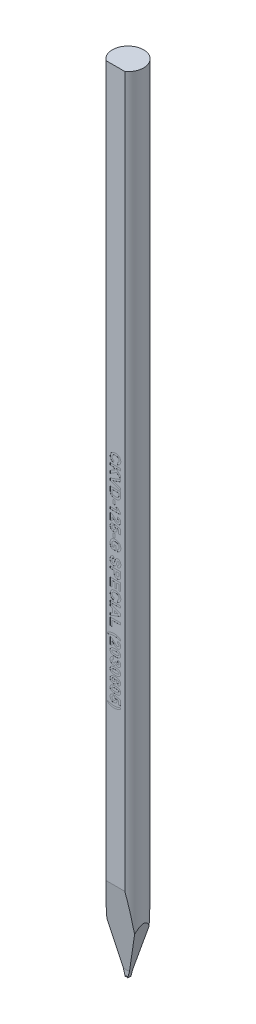
from build123d import *

# Parameters (mm, degrees)
SKETCH_TL_CUTTING_R       = 1.4986
TL_CUTTING_DEPTH          = 75.9968
SKETCH_TDF_GRINDING_W     = 3.0172
SKETCH_TDF_GRINDING_H     = 3.0172
TDF_GRINDING_DEPTH        = 77.026345527
SKETCH_ENGRAVING_W        = 0.166666667
SKETCH_ENGRAVING_H        = 0.371794872
SKETCH_ENGRAVING_W_2      = 1
SKETCH_ENGRAVING_H_2      = 0.192307693
ENGRAVING_DEPTH           = 0.005
VW_VR_GRINDING_DEPTH      = 1.5086
VW_VR_GRINDING_DEPTH_BACK = 1.5086
ISA_GRINDING_DEPTH        = 1.5086
ISA_GRINDING_DEPTH_BACK   = 1.5086
PRE_FRX_BRX_DEPTH         = 1.5086
PRE_FRX_BRX_DEPTH_BACK    = 1.5086
SKETCH_PRE_FRX_BRX_W      = 1.35874
SKETCH_PRE_FRX_BRX_H      = 0.6096
FR_EDM_R                  = 0.0381
BR_EDM_R                  = 0.0381
FA_BA_GRINDING_DEPTH      = 1.5086
FA_BA_GRINDING_DEPTH_BACK = 1.5086


with BuildPart() as part:
    # sketch_TL_cutting → TL_cutting (new body)
    with BuildSketch(Plane(origin=(0, 0, 0), x_dir=(1, 0, 0), z_dir=(0, 1, 0))):
        Circle(SKETCH_TL_CUTTING_R)
    extrude(amount=TL_CUTTING_DEPTH)

    # sketch_TDF_grinding → TDF_grinding (cut, through all)
    with BuildSketch(Plane(origin=(0, 0, 0), x_dir=(1, 0, 0), z_dir=(0, 1, 0))):
        with Locations((0, -2.71002)):
            Rectangle(SKETCH_TDF_GRINDING_W, SKETCH_TDF_GRINDING_H)
    extrude(amount=TDF_GRINDING_DEPTH, mode=Mode.SUBTRACT)

    # sketch_engraving → engraving (cut)
    # profile 1 of 26: a face of its own
    with BuildSketch(Plane.XY.offset(1.20142)):
        with BuildLine():
            Line((-0.128205128, 43.253210256), (-0.192307692, 43.060902564))
            add(Edge.make_bspline(
                [(-0.192307692, 43.060902564), (-0.204917923, 43.064809052), (-0.229612721, 43.072459184), (-0.2649877, 43.086537804), (-0.297871332, 43.102532008), (-0.328259475, 43.120359875), (-0.356049464, 43.140095258), (-0.381471598, 43.161589244), (-0.404368127, 43.185053424), (-0.424673345, 43.210470624), (-0.442633936, 43.237563711), (-0.457816548, 43.266656053), (-0.470893242, 43.29731117), (-0.481488041, 43.329840557), (-0.489972889, 43.364028151), (-0.495577171, 43.400034413), (-0.499377062, 43.437690896), (-0.499789062, 43.463403283), (-0.5, 43.476567628)],
                knots=[0, 0, 0, 0, 1.126670901, 2.206376047, 3.246533763, 4.245677351, 5.210506282, 6.152793389, 7.083980095, 8.004497442, 8.926231833, 9.854395169, 10.801995143, 11.768203916, 12.771938831, 13.805609698, 14.87650608, 16, 16, 16, 16], degree=3))
            add(Edge.make_bspline(
                [(-0.5, 43.476567628), (-0.499663994, 43.492816309), (-0.499003061, 43.524777949), (-0.492350465, 43.571519052), (-0.481969511, 43.616060328), (-0.467601869, 43.658469613), (-0.448555271, 43.698448786), (-0.42571373, 43.736373108), (-0.398318662, 43.771809391), (-0.367249987, 43.804950716), (-0.332452821, 43.835079196), (-0.294134751, 43.861072297), (-0.253074131, 43.883610491), (-0.208709772, 43.901536594), (-0.161353037, 43.915621791), (-0.110975156, 43.925468328), (-0.057578507, 43.931634942), (-0.020984357, 43.932337083), (-0.002203526, 43.932697436)],
                knots=[0, 0, 0, 0, 1.025134988, 2.016471176, 2.973446247, 3.909197306, 4.836872559, 5.763618465, 6.698581235, 7.658772073, 8.627106982, 9.597494692, 10.576422683, 11.578339294, 12.6118974, 13.690673505, 14.814808564, 16, 16, 16, 16], degree=3))
            add(Edge.make_bspline(
                [(-0.002203526, 43.932697436), (0.017576475, 43.9323292), (0.056163648, 43.931610839), (0.112313555, 43.925562878), (0.165084042, 43.915516768), (0.214577853, 43.901940058), (0.260470573, 43.883729249), (0.303160692, 43.861873909), (0.342311169, 43.835756152), (0.377833814, 43.805831091), (0.409480853, 43.772697852), (0.437377469, 43.736993428), (0.460593243, 43.698491041), (0.479896446, 43.657667336), (0.494630503, 43.614223397), (0.505304611, 43.568276602), (0.511505561, 43.519806054), (0.512376199, 43.48666808), (0.512820513, 43.469756731)],
                knots=[0, 0, 0, 0, 1.212773307, 2.365899439, 3.458117515, 4.504331001, 5.50806732, 6.480562534, 7.440239902, 8.387651817, 9.323121479, 10.245404239, 11.160468186, 12.07454208, 13.009500751, 13.96802424, 14.963018902, 16, 16, 16, 16], degree=3))
            add(Edge.make_bspline(
                [(0.512820513, 43.469756731), (0.512448361, 43.454987276), (0.511718707, 43.426029796), (0.506761415, 43.383624506), (0.498061698, 43.343436158), (0.486319015, 43.305247521), (0.470821797, 43.269275987), (0.451884357, 43.235457111), (0.429606892, 43.203674651), (0.412205553, 43.184525065), (0.403445513, 43.174884936)],
                knots=[0, 0, 0, 0, 1.098510076, 2.153775193, 3.169777012, 4.153122333, 5.120892526, 6.076995459, 7.031936742, 8, 8, 8, 8], degree=3))
            add(Edge.make_bspline(
                [(0.403445513, 43.174884936), (0.39787141, 43.169297644), (0.386592274, 43.157991818), (0.367549896, 43.142895368), (0.347050772, 43.128582058), (0.324745215, 43.115279068), (0.30046466, 43.103406849), (0.274581981, 43.092394097), (0.246997406, 43.082255069), (0.227800247, 43.076616604), (0.217948718, 43.073723077)],
                knots=[0, 0, 0, 0, 0.885292881, 1.791380647, 2.722937556, 3.69093542, 4.703306561, 5.754477758, 6.847650944, 8, 8, 8, 8], degree=3))
            Line((0.217948718, 43.073723077), (0.179487179, 43.266030769))
            add(Edge.make_bspline(
                [(0.179487179, 43.266030769), (0.1857949, 43.267665288), (0.198219456, 43.270884861), (0.21607256, 43.27739955), (0.233014714, 43.284871208), (0.248625569, 43.2941361), (0.263619506, 43.303962074), (0.277222328, 43.315624773), (0.290109132, 43.328129754), (0.301694454, 43.342018861), (0.312145605, 43.356893589), (0.321339918, 43.372603983), (0.329014435, 43.389188478), (0.335156827, 43.406521754), (0.340319842, 43.424545702), (0.34350638, 43.443432147), (0.345953545, 43.463015752), (0.3460861, 43.476358875), (0.346153846, 43.483178205)],
                knots=[0, 0, 0, 0, 1.051114734, 2.070420253, 3.064047898, 4.034553068, 4.997066449, 5.953344811, 6.921213386, 7.892675544, 8.867420182, 9.852654213, 10.826683617, 11.811917648, 12.818610352, 13.848120519, 14.900229319, 16, 16, 16, 16], degree=3))
            add(Edge.make_bspline(
                [(0.346153846, 43.483178205), (0.345958725, 43.492542256), (0.345576529, 43.51088423), (0.341532101, 43.53761448), (0.335695112, 43.563055692), (0.326982094, 43.58711706), (0.315677399, 43.609731698), (0.302244603, 43.631228905), (0.286035184, 43.651060806), (0.26758257, 43.669699764), (0.246135655, 43.686407721), (0.221779967, 43.701110652), (0.194212535, 43.713304121), (0.163711493, 43.723204409), (0.130202077, 43.730996736), (0.093641969, 43.736561162), (0.054005962, 43.739638434), (0.026581025, 43.740133903), (0.012419872, 43.740389744)],
                knots=[0, 0, 0, 0, 0.93816214, 1.837638998, 2.704791736, 3.551915875, 4.396257554, 5.235807848, 6.087970119, 6.959042444, 7.860386085, 8.80649345, 9.804409709, 10.875695391, 12.017327537, 13.250155505, 14.580089023, 16, 16, 16, 16], degree=3))
            add(Edge.make_bspline(
                [(0.012419872, 43.740389744), (-0.002609028, 43.740136423), (-0.031567402, 43.739648312), (-0.073337178, 43.736571685), (-0.111754322, 43.730971705), (-0.14688701, 43.723282849), (-0.178713725, 43.713332973), (-0.207179389, 43.701159106), (-0.23231734, 43.686686701), (-0.254110839, 43.669938275), (-0.272831387, 43.651337256), (-0.288926796, 43.631387439), (-0.302688307, 43.610206524), (-0.314010391, 43.587667053), (-0.322575422, 43.563683298), (-0.328786932, 43.538452371), (-0.332735688, 43.511881695), (-0.333131326, 43.493675799), (-0.333333333, 43.484380128)],
                knots=[0, 0, 0, 0, 1.475208372, 2.842499301, 4.107722225, 5.282836115, 6.369007568, 7.375918121, 8.315702116, 9.208439171, 10.065831443, 10.90006451, 11.71996243, 12.54067204, 13.369972975, 14.214060185, 15.088124569, 16, 16, 16, 16], degree=3))
            add(Edge.make_bspline(
                [(-0.333333333, 43.484380128), (-0.333161634, 43.477497953), (-0.332824013, 43.463965176), (-0.330681155, 43.443962689), (-0.326591822, 43.42476438), (-0.321184418, 43.406276281), (-0.314399721, 43.388426559), (-0.305696319, 43.37148748), (-0.295693052, 43.355125777), (-0.283969989, 43.33968094), (-0.270808612, 43.324946156), (-0.255597341, 43.311507159), (-0.238701667, 43.299041373), (-0.220008678, 43.287706947), (-0.199678377, 43.27712516), (-0.177394008, 43.268122121), (-0.153515697, 43.259734984), (-0.136789345, 43.255423153), (-0.128205128, 43.253210256)],
                knots=[0, 0, 0, 0, 0.980177776, 1.927374078, 2.859849964, 3.771585772, 4.668674471, 5.574490016, 6.479656464, 7.396337719, 8.332153134, 9.288470092, 10.28125149, 11.318486971, 12.398724812, 13.541284404, 14.738150009, 16, 16, 16, 16], degree=3))
        make_face()
    # profile 2 of 26: a face of its own
    with BuildSketch(Plane.XY.offset(1.20142)):
        Polygon((-0.5, 42.894235897), (0.5, 42.894235897), (0.5, 42.701928205), (0.052283654, 42.701928205), (0.5, 42.280253526), (0.5, 42.016030769), (0.11338141, 42.395838462), (-0.5, 42.003210256), (-0.5, 42.259420192), (-0.035456731, 42.541671795), (-0.198517628, 42.701928205), (-0.5, 42.701928205), align=None)
    # profile 3 of 26: a face of its own
    with BuildSketch(Plane.XY.offset(1.20142)):
        Polygon((-0.5, 41.627008333), (0.5, 41.9968), (0.5, 41.793675), (-0.243589744, 41.528851282), (0.5, 41.265029167), (0.5, 41.060902564), (-0.5, 41.429291987), align=None)
    # profile 4 of 26: a face of its own
    with BuildSketch(Plane.XY.offset(1.20142)):
        with BuildLine():
            Line((0.5, 40.971158974), (0.5, 40.604372115))
            add(Edge.make_bspline(
                [(0.5, 40.604372115), (0.500005193, 40.594354571), (0.500015306, 40.574848084), (0.498840892, 40.546539066), (0.497659587, 40.520066494), (0.495294873, 40.495506352), (0.492816233, 40.472773432), (0.489678088, 40.451826942), (0.485656212, 40.432799202), (0.482484481, 40.420800319), (0.480969551, 40.415069231)],
                knots=[0, 0, 0, 0, 1.259756885, 2.453039283, 3.563158368, 4.591894114, 5.55549294, 6.43918076, 7.254497783, 8, 8, 8, 8], degree=3))
            add(Edge.make_bspline(
                [(0.480969551, 40.415069231), (0.478637325, 40.407900254), (0.474014881, 40.393691431), (0.465827813, 40.372838378), (0.455960096, 40.353004479), (0.445111978, 40.333729819), (0.432903728, 40.315457553), (0.419595761, 40.297742873), (0.404753223, 40.281109803), (0.383633179, 40.25957514), (0.35420815, 40.235150255), (0.315375005, 40.20931972), (0.272594656, 40.187582014), (0.234409605, 40.172390641), (0.20183843, 40.162346542), (0.175754603, 40.155778141), (0.148301213, 40.150106468), (0.119383738, 40.145856292), (0.08913491, 40.142194906), (0.057465542, 40.139567238), (0.024383276, 40.13826625), (0.001870575, 40.137974494), (-0.009615385, 40.137825641)],
                knots=[0, 0, 0, 0, 0.745431882, 1.477436776, 2.212739876, 2.934276521, 3.663147754, 4.384200836, 5.123377481, 5.865761747, 7.365547505, 8.894711587, 10.468722596, 12.101948761, 12.951987285, 13.837595333, 14.760899389, 15.722756883, 16.726861385, 17.773652936, 18.864119771, 20, 20, 20, 20], degree=3))
            add(Edge.make_bspline(
                [(-0.009615385, 40.137825641), (-0.0294616, 40.138217046), (-0.067834928, 40.13897384), (-0.123301552, 40.144571211), (-0.17465514, 40.153866648), (-0.206804138, 40.163577075), (-0.222355769, 40.168274359)],
                knots=[0, 0, 0, 0, 1.103491527, 2.133638164, 3.0971734, 4, 4, 4, 4], degree=3))
            add(Edge.make_bspline(
                [(-0.222355769, 40.168274359), (-0.231274521, 40.171448003), (-0.248819098, 40.177691057), (-0.274127236, 40.188615932), (-0.298211673, 40.200420337), (-0.321053432, 40.213202184), (-0.342549771, 40.227026052), (-0.362636394, 40.241943645), (-0.381577746, 40.257723731), (-0.393236239, 40.26915549), (-0.399038462, 40.274844872)],
                knots=[0, 0, 0, 0, 1.090884612, 2.145940218, 3.175104604, 4.181306866, 5.161203701, 6.118658341, 7.063689906, 8, 8, 8, 8], degree=3))
            add(Edge.make_bspline(
                [(-0.399038462, 40.274844872), (-0.407300305, 40.284131145), (-0.424264154, 40.303198431), (-0.445652736, 40.33654995), (-0.464086504, 40.374425276), (-0.473760833, 40.401739168), (-0.478766026, 40.415870513)],
                knots=[0, 0, 0, 0, 0.912008655, 1.872605891, 2.89935344, 4, 4, 4, 4], degree=3))
            add(Edge.make_bspline(
                [(-0.478766026, 40.415870513), (-0.4805228, 40.421590486), (-0.484168894, 40.433461996), (-0.488062998, 40.452285444), (-0.492165475, 40.472379947), (-0.49463687, 40.493977223), (-0.497243066, 40.516853081), (-0.498706299, 40.541189822), (-0.49974511, 40.566903081), (-0.499913777, 40.584539175), (-0.5, 40.593554808)],
                knots=[0, 0, 0, 0, 0.799129865, 1.658552685, 2.566799617, 3.538529252, 4.561352959, 5.643373779, 6.795284424, 8, 8, 8, 8], degree=3))
            Line((-0.5, 40.593554808), (-0.5, 40.971158974))
            Line((-0.5, 40.971158974), (0.5, 40.971158974))
        make_face()
        with BuildLine():
            Line((0.333333333, 40.778851282), (-0.333333333, 40.778851282))
            Line((-0.333333333, 40.778851282), (-0.333333333, 40.620598077))
            add(Edge.make_bspline(
                [(-0.333333333, 40.620598077), (-0.333276671, 40.61345336), (-0.333167574, 40.599697049), (-0.332847006, 40.579791316), (-0.331979167, 40.561498115), (-0.331080228, 40.544721614), (-0.329595022, 40.52950549), (-0.328134266, 40.515783535), (-0.326090699, 40.503632132), (-0.324477534, 40.496127127), (-0.323717949, 40.492593269)],
                knots=[0, 0, 0, 0, 1.333384787, 2.567275092, 3.714769766, 4.750907381, 5.701951617, 6.567520054, 7.325492842, 8, 8, 8, 8], degree=3))
            add(Edge.make_bspline(
                [(-0.323717949, 40.492593269), (-0.321509316, 40.484316575), (-0.317207482, 40.468195757), (-0.307617456, 40.445560499), (-0.296048139, 40.425078507), (-0.282136533, 40.40640677), (-0.26455548, 40.38957967), (-0.242070693, 40.375215683), (-0.215254411, 40.361922192), (-0.189584523, 40.352818806), (-0.16665678, 40.346284413), (-0.147412959, 40.341861165), (-0.126593091, 40.338365591), (-0.104279343, 40.335358942), (-0.080500412, 40.332929499), (-0.055170426, 40.331417784), (-0.028320392, 40.330386029), (-0.009883527, 40.330219161), (-0.000400641, 40.330133333)],
                knots=[0, 0, 0, 0, 1.038686998, 2.023088296, 2.974059649, 3.888265163, 4.839857954, 5.909819677, 7.113156087, 8.466843969, 9.20827164, 10.006482943, 10.861893492, 11.769681931, 12.739021491, 13.762258324, 14.849031541, 16, 16, 16, 16], degree=3))
            add(Edge.make_bspline(
                [(-0.000400641, 40.330133333), (0.009082275, 40.3302185), (0.027452469, 40.330383485), (0.054102292, 40.331413664), (0.079033415, 40.332916863), (0.102276578, 40.335363691), (0.123864169, 40.338323456), (0.143813574, 40.341860891), (0.161996804, 40.346254423), (0.183589283, 40.352807511), (0.207947697, 40.362644996), (0.23429421, 40.376471199), (0.2571147, 40.392736402), (0.276689574, 40.411091558), (0.29287817, 40.432178569), (0.306422028, 40.455549371), (0.316938162, 40.481680279), (0.321416742, 40.500269318), (0.323717949, 40.509820833)],
                knots=[0, 0, 0, 0, 1.118059345, 2.165891593, 3.144157881, 4.062285166, 4.920717571, 5.712910489, 6.449981617, 7.12489426, 8.371943983, 9.541298068, 10.624898781, 11.666293176, 12.69306237, 13.747704633, 14.842713931, 16, 16, 16, 16], degree=3))
            add(Edge.make_bspline(
                [(0.323717949, 40.509820833), (0.324486218, 40.513955143), (0.326177652, 40.523057311), (0.328151987, 40.538161571), (0.329628909, 40.555948179), (0.331099472, 40.576377116), (0.331977905, 40.599427064), (0.332859431, 40.625132571), (0.333166326, 40.653516851), (0.333276065, 40.673349207), (0.333333333, 40.683699038)],
                knots=[0, 0, 0, 0, 0.578739524, 1.274162912, 2.095457587, 3.035141998, 4.093102578, 5.270121571, 6.575369351, 8, 8, 8, 8], degree=3))
            Line((0.333333333, 40.683699038), (0.333333333, 40.778851282))
        make_face(mode=Mode.SUBTRACT)
    # profile 5 of 26: a face of its own
    with BuildSketch(Plane.XY.offset(1.20142)):
        with Locations((-0.147435898, 39.810902564)):
            Rectangle(SKETCH_ENGRAVING_W, SKETCH_ENGRAVING_H)
    # profile 6 of 26: a face of its own
    with BuildSketch(Plane.XY.offset(1.20142)):
        with BuildLine():
            Line((-0.5, 39.073723077), (-0.5, 39.266030769))
            Line((-0.5, 39.266030769), (0.211939103, 39.266030769))
            add(Edge.make_bspline(
                [(0.211939103, 39.266030769), (0.20307606, 39.274734852), (0.185434563, 39.292059945), (0.161132143, 39.319898193), (0.138107764, 39.348429498), (0.117325964, 39.378488613), (0.097979723, 39.409495994), (0.080691796, 39.441850822), (0.064587624, 39.475051895), (0.055729116, 39.498066792), (0.051282051, 39.509620513)],
                knots=[0, 0, 0, 0, 1.012608143, 2.015552075, 3.011331447, 4.000718745, 4.993456561, 5.989905615, 6.990911433, 8, 8, 8, 8], degree=3))
            Line((0.051282051, 39.509620513), (0.243589744, 39.509620513))
            add(Edge.make_bspline(
                [(0.243589744, 39.509620513), (0.248390063, 39.496812321), (0.258436757, 39.470005773), (0.279872721, 39.430420485), (0.306240788, 39.389010478), (0.332145905, 39.35426628), (0.355392216, 39.326940145), (0.373871139, 39.307698315), (0.392879523, 39.289874424), (0.412934946, 39.274123655), (0.433647484, 39.260045979), (0.454979242, 39.247571891), (0.476998664, 39.236591997), (0.492332462, 39.230844073), (0.5, 39.227969872)],
                knots=[0, 0, 0, 0, 1.253621181, 2.623731602, 4.119264342, 5.756158754, 6.594718004, 7.409281336, 8.202581069, 8.983291728, 9.746205797, 10.498494251, 11.24918464, 12, 12, 12, 12], degree=3))
            Line((0.5, 39.227969872), (0.5, 39.073723077))
            Line((0.5, 39.073723077), (-0.5, 39.073723077))
        make_face()
    # profile 7 of 26: a face of its own
    with BuildSketch(Plane.XY.offset(1.20142)):
        with BuildLine():
            Line((-0.307692308, 38.137825641), (-0.5, 38.137825641))
            Line((-0.5, 38.137825641), (-0.5, 38.791671795))
            add(Edge.make_bspline(
                [(-0.5, 38.791671795), (-0.483565984, 38.78945373), (-0.450707166, 38.785018845), (-0.402658764, 38.771392053), (-0.355879438, 38.752867325), (-0.317848438, 38.732961803), (-0.286923212, 38.713605861), (-0.262057708, 38.695394141), (-0.235074392, 38.674364437), (-0.206603976, 38.649813805), (-0.176093602, 38.622354752), (-0.14381225, 38.591645754), (-0.109876761, 38.557589959), (-0.086834533, 38.533628881), (-0.074919872, 38.521239103)],
                knots=[0, 0, 0, 0, 1.156381417, 2.312114436, 3.475445649, 4.663832578, 5.302694182, 6.020660876, 6.814180865, 7.69035705, 8.644181007, 9.679458435, 10.800095821, 12, 12, 12, 12], degree=3))
            add(Edge.make_bspline(
                [(-0.074919872, 38.521239103), (-0.065377972, 38.511350203), (-0.047213006, 38.492524652), (-0.021173696, 38.465746037), (0.002635387, 38.442138859), (0.024062885, 38.42156659), (0.042867348, 38.403755407), (0.059484162, 38.389184125), (0.073602098, 38.377398337), (0.082565079, 38.371021256), (0.086538462, 38.368194231)],
                knots=[0, 0, 0, 0, 1.480739016, 2.818890974, 4.024686436, 5.093297083, 6.019761393, 6.815071481, 7.474708909, 8, 8, 8, 8], degree=3))
            add(Edge.make_bspline(
                [(0.086538462, 38.368194231), (0.096145343, 38.362375339), (0.114654059, 38.351164601), (0.143960972, 38.33930553), (0.173010268, 38.331565463), (0.192528875, 38.330605306), (0.202123397, 38.330133333)],
                knots=[0, 0, 0, 0, 1.091434863, 2.102769638, 3.067401785, 4, 4, 4, 4], degree=3))
            add(Edge.make_bspline(
                [(0.202123397, 38.330133333), (0.212103794, 38.330486794), (0.230985925, 38.331155515), (0.257559137, 38.336948518), (0.280564781, 38.346776582), (0.299731306, 38.360789793), (0.314878913, 38.37843879), (0.325894297, 38.399195821), (0.332110851, 38.423133647), (0.33291372, 38.43993959), (0.333333333, 38.448723077)],
                knots=[0, 0, 0, 0, 1.192552326, 2.256215989, 3.232470907, 4.163657734, 5.069678789, 5.991331675, 6.950186205, 8, 8, 8, 8], degree=3))
            add(Edge.make_bspline(
                [(0.333333333, 38.448723077), (0.332938162, 38.457445314), (0.332174776, 38.474294793), (0.325505939, 38.498241559), (0.313961482, 38.519190559), (0.30080546, 38.534119931), (0.288012183, 38.544205429), (0.276863686, 38.551077336), (0.264195574, 38.557000384), (0.250150469, 38.562248698), (0.23456747, 38.566394273), (0.217565257, 38.569732861), (0.199052334, 38.57242328), (0.186173423, 38.573278881), (0.179487179, 38.573723077)],
                knots=[0, 0, 0, 0, 1.402788338, 2.709884207, 3.961032948, 5.225417836, 5.883680772, 6.578928686, 7.329201998, 8.132101139, 8.990263233, 9.922304639, 10.921339128, 12, 12, 12, 12], degree=3))
            Line((0.179487179, 38.573723077), (0.198317308, 38.766030769))
            add(Edge.make_bspline(
                [(0.198317308, 38.766030769), (0.211300501, 38.764484645), (0.236472838, 38.761486958), (0.272628993, 38.754006178), (0.305984679, 38.744532048), (0.336477992, 38.732612904), (0.364302841, 38.718741378), (0.389041697, 38.702209908), (0.410968596, 38.68359612), (0.430071868, 38.662883927), (0.446412285, 38.640205005), (0.460998615, 38.616407545), (0.472964043, 38.591026479), (0.482825353, 38.564341253), (0.490706433, 38.536363927), (0.495917297, 38.506965102), (0.499582638, 38.476326216), (0.499858783, 38.455411985), (0.5, 38.444716667)],
                knots=[0, 0, 0, 0, 1.270971563, 2.464210789, 3.586263665, 4.638946707, 5.643716971, 6.603612468, 7.52484387, 8.434700188, 9.336036235, 10.239171475, 11.145359471, 12.059630629, 13.003312604, 13.96741569, 14.960557767, 16, 16, 16, 16], degree=3))
            add(Edge.make_bspline(
                [(0.5, 38.444716667), (0.499776553, 38.433089459), (0.499341362, 38.410444013), (0.495746905, 38.377385933), (0.489481026, 38.346329303), (0.48117587, 38.317006916), (0.470106061, 38.289704654), (0.456633778, 38.264201031), (0.440545401, 38.240755198), (0.422288069, 38.219341878), (0.402418882, 38.20012264), (0.380890105, 38.183668357), (0.358545244, 38.169222556), (0.334632005, 38.157882632), (0.309750235, 38.148643646), (0.283460918, 38.14269893), (0.256153456, 38.13835187), (0.237464899, 38.138002991), (0.227964744, 38.137825641)],
                knots=[0, 0, 0, 0, 1.21054264, 2.357683783, 3.456743179, 4.506371233, 5.526380269, 6.518616322, 7.504105716, 8.480749833, 9.444588379, 10.376395364, 11.298423092, 12.209585683, 13.126776925, 14.056012185, 15.011791738, 16, 16, 16, 16], degree=3))
            add(Edge.make_bspline(
                [(0.227964744, 38.137825641), (0.217064496, 38.138070753), (0.195440077, 38.138557019), (0.163469012, 38.143197463), (0.132249846, 38.15032211), (0.101610438, 38.16072983), (0.071147148, 38.174402099), (0.040108962, 38.191139636), (0.008522341, 38.211412701), (-0.012178306, 38.226838447), (-0.022836538, 38.234780769)],
                knots=[0, 0, 0, 0, 0.953498, 1.891593709, 2.82157134, 3.753035249, 4.718494268, 5.740911752, 6.836853288, 8, 8, 8, 8], degree=3))
            add(Edge.make_bspline(
                [(-0.022836538, 38.234780769), (-0.026670091, 38.237819514), (-0.034880672, 38.2443278), (-0.047378398, 38.2554334), (-0.061345658, 38.268037883), (-0.076193638, 38.282719221), (-0.092563957, 38.298938211), (-0.109838998, 38.317124609), (-0.128325502, 38.337094679), (-0.147648705, 38.35804585), (-0.166391428, 38.379206854), (-0.184247543, 38.398553147), (-0.20029985, 38.415885953), (-0.214732899, 38.431037917), (-0.227268639, 38.444275167), (-0.238167377, 38.455345188), (-0.247265417, 38.464426315), (-0.26144337, 38.476942593), (-0.280620183, 38.492867112), (-0.298943771, 38.504070955), (-0.307692308, 38.509420192)],
                knots=[0, 0, 0, 0, 0.665546509, 1.425446362, 2.274432636, 3.225431318, 4.2662943, 5.410247296, 6.638261485, 7.969509561, 9.288545809, 10.484715594, 11.551975365, 12.503234464, 13.332293902, 14.032657109, 14.617374704, 15.080693821, 16.606187002, 18, 18, 18, 18], degree=3))
            Line((-0.307692308, 38.509420192), (-0.307692308, 38.137825641))
        make_face()
    # profile 8 of 26: a face of its own
    with BuildSketch(Plane.XY.offset(1.20142)):
        with BuildLine():
            Line((-0.213942308, 38.022441026), (-0.192307692, 37.855774359))
            add(Edge.make_bspline(
                [(-0.192307692, 37.855774359), (-0.203607347, 37.853925287), (-0.225366694, 37.850364594), (-0.255826929, 37.839402289), (-0.282470914, 37.823774379), (-0.305088238, 37.804100221), (-0.323334969, 37.781657307), (-0.336523954, 37.756988423), (-0.344692684, 37.73061856), (-0.34566455, 37.712335111), (-0.346153846, 37.703130128)],
                knots=[0, 0, 0, 0, 1.155217688, 2.224562036, 3.249849536, 4.259092678, 5.238040954, 6.15568152, 7.071459712, 8, 8, 8, 8], degree=3))
            add(Edge.make_bspline(
                [(-0.346153846, 37.703130128), (-0.346059894, 37.697781574), (-0.34587598, 37.687311695), (-0.34378776, 37.671882996), (-0.340396301, 37.657143672), (-0.335789422, 37.642957438), (-0.329745146, 37.629460443), (-0.322266898, 37.616637002), (-0.313608966, 37.604329211), (-0.303697677, 37.592693735), (-0.29215854, 37.582251042), (-0.27939506, 37.572976485), (-0.265101057, 37.5653888), (-0.249674797, 37.558847437), (-0.232663378, 37.554219777), (-0.214481969, 37.550508153), (-0.194883734, 37.548622529), (-0.18142672, 37.548266079), (-0.174479167, 37.548082051)],
                knots=[0, 0, 0, 0, 0.98109136, 1.920501424, 2.850996269, 3.75396817, 4.653607445, 5.559568228, 6.474190795, 7.412641135, 8.358186253, 9.324081521, 10.300185094, 11.322066343, 12.392681767, 13.529496655, 14.72453472, 16, 16, 16, 16], degree=3))
            add(Edge.make_bspline(
                [(-0.174479167, 37.548082051), (-0.167930185, 37.548186011), (-0.155273198, 37.54838693), (-0.136935362, 37.550250991), (-0.119798482, 37.553112314), (-0.103987864, 37.557664229), (-0.089209555, 37.562862865), (-0.075987454, 37.569871975), (-0.063746794, 37.577562624), (-0.053149329, 37.586936842), (-0.04378212, 37.597149194), (-0.035449479, 37.608031526), (-0.028416647, 37.619729056), (-0.022600846, 37.632131092), (-0.018105451, 37.64529127), (-0.015265585, 37.659238292), (-0.013079926, 37.673815526), (-0.012907894, 37.683823789), (-0.012820513, 37.688907372)],
                knots=[0, 0, 0, 0, 1.292262537, 2.497510385, 3.635136149, 4.715991128, 5.741845981, 6.720379908, 7.663568786, 8.58853187, 9.502632107, 10.396263742, 11.289117461, 12.191261909, 13.095714127, 14.026387781, 14.997526353, 16, 16, 16, 16], degree=3))
            add(Edge.make_bspline(
                [(-0.012820513, 37.688907372), (-0.013050924, 37.695334203), (-0.013510598, 37.708155832), (-0.017247301, 37.72708286), (-0.02333068, 37.745505311), (-0.031799166, 37.763404039), (-0.042720432, 37.780731687), (-0.056130694, 37.797413237), (-0.071799231, 37.813735037), (-0.083638008, 37.823760833), (-0.08974359, 37.82893141)],
                knots=[0, 0, 0, 0, 0.931687088, 1.85873035, 2.786835662, 3.740075265, 4.723687035, 5.750832598, 6.840042753, 8, 8, 8, 8], degree=3))
            Line((-0.08974359, 37.82893141), (-0.066105769, 37.9968))
            Line((-0.066105769, 37.9968), (0.487179487, 37.881415385))
            Line((0.487179487, 37.881415385), (0.487179487, 37.394235897))
            Line((0.487179487, 37.394235897), (0.294871795, 37.394235897))
            Line((0.294871795, 37.394235897), (0.294871795, 37.72716859))
            Line((0.294871795, 37.72716859), (0.116386218, 37.76643141))
            add(Edge.make_bspline(
                [(0.116386218, 37.76643141), (0.122158957, 37.756426118), (0.133400829, 37.736941744), (0.144973305, 37.705834811), (0.152400706, 37.674568082), (0.153366831, 37.653490949), (0.153846154, 37.643033974)],
                knots=[0, 0, 0, 0, 1.060051984, 2.064352337, 3.039669322, 4, 4, 4, 4], degree=3))
            add(Edge.make_bspline(
                [(0.153846154, 37.643033974), (0.153581613, 37.63320353), (0.153059042, 37.613784594), (0.148771515, 37.585305103), (0.141705229, 37.557987857), (0.131871753, 37.531740611), (0.118982632, 37.506751105), (0.103404168, 37.482803913), (0.084866032, 37.460244757), (0.063903438, 37.438831251), (0.04071085, 37.419303636), (0.015420507, 37.402439987), (-0.011337699, 37.387874676), (-0.039859413, 37.376016787), (-0.070184315, 37.367087457), (-0.102051282, 37.360400252), (-0.135661543, 37.356654127), (-0.158578281, 37.356071611), (-0.170272436, 37.355774359)],
                knots=[0, 0, 0, 0, 0.974409932, 1.924837087, 2.848242317, 3.768103797, 4.697919751, 5.630842317, 6.595644344, 7.588240789, 8.59876155, 9.595918743, 10.597287627, 11.615415169, 12.652315553, 13.727511434, 14.840374562, 16, 16, 16, 16], degree=3))
            add(Edge.make_bspline(
                [(-0.170272436, 37.355774359), (-0.180095164, 37.356040651), (-0.199591316, 37.356569189), (-0.228431015, 37.359713123), (-0.256480502, 37.365423218), (-0.283660862, 37.373230645), (-0.310181667, 37.383074441), (-0.335760069, 37.395318254), (-0.360613268, 37.409811181), (-0.376286294, 37.421018447), (-0.384214744, 37.426687821)],
                knots=[0, 0, 0, 0, 1.0275977, 2.039576086, 3.029943557, 4.018141221, 4.995043124, 5.985410594, 6.980887897, 8, 8, 8, 8], degree=3))
            add(Edge.make_bspline(
                [(-0.384214744, 37.426687821), (-0.39442561, 37.434949332), (-0.414521783, 37.451208948), (-0.440928765, 37.479051257), (-0.463196136, 37.509349396), (-0.481238657, 37.542072985), (-0.495700415, 37.576950225), (-0.505577236, 37.614346022), (-0.511741284, 37.653979771), (-0.51245553, 37.681205058), (-0.512820513, 37.695117308)],
                knots=[0, 0, 0, 0, 1.018155984, 2.003849412, 2.967446846, 3.927472908, 4.896208823, 5.888955604, 6.921246412, 8, 8, 8, 8], degree=3))
            add(Edge.make_bspline(
                [(-0.512820513, 37.695117308), (-0.51261689, 37.70634638), (-0.512219305, 37.728271757), (-0.508313832, 37.760385425), (-0.50189785, 37.790864306), (-0.493201931, 37.819853414), (-0.481586571, 37.847077466), (-0.467806969, 37.872870679), (-0.451267563, 37.897036267), (-0.432181131, 37.919432086), (-0.411081442, 37.939996376), (-0.387995531, 37.958339148), (-0.363308362, 37.974659322), (-0.336770788, 37.98864566), (-0.308568836, 38.00056532), (-0.278557994, 38.010056256), (-0.246938394, 38.017870613), (-0.225062746, 38.020900692), (-0.213942308, 38.022441026)],
                knots=[0, 0, 0, 0, 1.098896741, 2.145655864, 3.16104256, 4.145315902, 5.10323158, 6.053780891, 7.003858069, 7.963890296, 8.930045353, 9.883557002, 10.846278307, 11.82296847, 12.816080213, 13.83936887, 14.901647787, 16, 16, 16, 16], degree=3))
        make_face()
    # profile 9 of 26: a face of its own
    with BuildSketch(Plane.XY.offset(1.20142)):
        with Locations((-0.147435898, 37.041671795)):
            Rectangle(SKETCH_ENGRAVING_W, SKETCH_ENGRAVING_H)
    # profile 10 of 26: a face of its own
    with BuildSketch(Plane.XY.offset(1.20142)):
        with BuildLine():
            Line((-0.128205128, 36.291671795), (0.038461538, 36.291671795))
            Line((0.038461538, 36.291671795), (0.038461538, 35.855774359))
            Line((0.038461538, 35.855774359), (-0.36338141, 35.855774359))
            add(Edge.make_bspline(
                [(-0.36338141, 35.855774359), (-0.368321434, 35.861260375), (-0.378419843, 35.8724749), (-0.392661125, 35.890772664), (-0.406257259, 35.910916779), (-0.4194836, 35.932785469), (-0.432233696, 35.956423992), (-0.444685123, 35.981738064), (-0.45671611, 36.008774391), (-0.471787381, 36.047007711), (-0.488186169, 36.09622183), (-0.502445448, 36.156387076), (-0.511191227, 36.217028267), (-0.512277771, 36.257589075), (-0.512820513, 36.277849679)],
                knots=[0, 0, 0, 0, 0.581799769, 1.189316438, 1.825828404, 2.496525428, 3.203088405, 3.942228803, 4.719818701, 5.534979611, 7.181138583, 8.803804008, 10.403462225, 12, 12, 12, 12], degree=3))
            add(Edge.make_bspline(
                [(-0.512820513, 36.277849679), (-0.512629241, 36.290542166), (-0.512252188, 36.315562831), (-0.509233571, 36.352501118), (-0.504017902, 36.388218224), (-0.496780719, 36.422650736), (-0.487836372, 36.455901646), (-0.476607913, 36.487854166), (-0.463065488, 36.518474068), (-0.447986133, 36.547990581), (-0.430657849, 36.575843177), (-0.411724289, 36.602087023), (-0.390891397, 36.626467404), (-0.36853351, 36.649196217), (-0.344060025, 36.669844803), (-0.318106216, 36.688926641), (-0.290219674, 36.705985038), (-0.260879177, 36.721311559), (-0.230317098, 36.734940942), (-0.198781008, 36.746443246), (-0.166726875, 36.756526922), (-0.134042675, 36.764814707), (-0.10062201, 36.770901654), (-0.066619552, 36.775633529), (-0.031822841, 36.778175004), (-0.008417054, 36.778624325), (0.003405449, 36.778851282)],
                knots=[0, 0, 0, 0, 1.124897971, 2.217508473, 3.282174662, 4.322209414, 5.334422951, 6.332119154, 7.320662553, 8.300074908, 9.267468154, 10.225199689, 11.165658754, 12.107290334, 13.047749399, 14.00069605, 14.959944213, 15.942088746, 16.933021067, 17.923599838, 18.915715637, 19.910475908, 20.909926025, 21.925232038, 22.952013513, 24, 24, 24, 24], degree=3))
            add(Edge.make_bspline(
                [(0.003405449, 36.778851282), (0.016165747, 36.778667383), (0.041321811, 36.778304838), (0.078501182, 36.775175194), (0.114594914, 36.770327239), (0.149519517, 36.762932247), (0.183523729, 36.754078796), (0.216299841, 36.742734109), (0.248180515, 36.729780661), (0.278688999, 36.714496543), (0.308028284, 36.697613971), (0.335510174, 36.6784304), (0.361403632, 36.6576108), (0.385591047, 36.634967968), (0.407627145, 36.610129007), (0.428063784, 36.583603308), (0.447146094, 36.55540846), (0.457908016, 36.535231736), (0.463341346, 36.525045192)],
                knots=[0, 0, 0, 0, 1.105132952, 2.178694671, 3.229818344, 4.257558797, 5.269123684, 6.27148554, 7.259679084, 8.247804916, 9.224967877, 10.189258471, 11.147685264, 12.101072275, 13.055511435, 14.02039165, 15.000562851, 16, 16, 16, 16], degree=3))
            add(Edge.make_bspline(
                [(0.463341346, 36.525045192), (0.467347168, 36.516957841), (0.475455657, 36.500587618), (0.485329628, 36.474514525), (0.494054347, 36.447146948), (0.500719187, 36.418165473), (0.506115234, 36.387878993), (0.510216979, 36.356137917), (0.512307439, 36.322883708), (0.512647258, 36.300221284), (0.512820513, 36.288666987)],
                knots=[0, 0, 0, 0, 0.887950456, 1.797368171, 2.741221183, 3.713797788, 4.722103116, 5.768966405, 6.862521341, 8, 8, 8, 8], degree=3))
            add(Edge.make_bspline(
                [(0.512820513, 36.288666987), (0.512598613, 36.273769487), (0.512167059, 36.244796604), (0.508571106, 36.20255631), (0.502373597, 36.162802674), (0.493837942, 36.125480334), (0.482863355, 36.090669697), (0.469371425, 36.058430687), (0.453633675, 36.028565429), (0.435019378, 36.001506485), (0.414494937, 35.976703918), (0.392035387, 35.954222449), (0.367607461, 35.934053031), (0.341334074, 35.916182318), (0.313106625, 35.900750967), (0.283182558, 35.887482952), (0.251334696, 35.876561769), (0.22921692, 35.871283803), (0.217948718, 35.868594872)],
                knots=[0, 0, 0, 0, 1.271135529, 2.472123572, 3.614091059, 4.701890498, 5.736279567, 6.724681829, 7.680621489, 8.611506429, 9.52200816, 10.424540711, 11.318996785, 12.221421405, 13.131851814, 14.060431888, 15.011860567, 16, 16, 16, 16], degree=3))
            Line((0.217948718, 35.868594872), (0.179487179, 36.060902564))
            add(Edge.make_bspline(
                [(0.179487179, 36.060902564), (0.185798707, 36.062805146), (0.198251232, 36.066558905), (0.216108293, 36.073865481), (0.232994438, 36.082183603), (0.248643132, 36.092010597), (0.263649233, 36.102448251), (0.277161531, 36.114718435), (0.290187329, 36.127625453), (0.301701762, 36.142116609), (0.312086782, 36.157555164), (0.321450083, 36.173776632), (0.329043783, 36.191144974), (0.335153652, 36.209417597), (0.340342569, 36.228505002), (0.343533767, 36.24865634), (0.345940549, 36.2696453), (0.346081986, 36.283985325), (0.346153846, 36.291271154)],
                knots=[0, 0, 0, 0, 1.027780279, 2.027791312, 3.006028774, 3.96000864, 4.908113241, 5.852721087, 6.802883308, 7.765918715, 8.733730415, 9.704005314, 10.683351261, 11.68471758, 12.707948499, 13.764514378, 14.864202456, 16, 16, 16, 16], degree=3))
            add(Edge.make_bspline(
                [(0.346153846, 36.291271154), (0.345859633, 36.302298511), (0.34528545, 36.323819337), (0.341538784, 36.355236876), (0.334873123, 36.384876442), (0.325679114, 36.41281554), (0.313877959, 36.439105391), (0.299029501, 36.463390737), (0.282012344, 36.48627627), (0.262039987, 36.507110747), (0.239645267, 36.52600525), (0.214561065, 36.542361822), (0.186868462, 36.555978599), (0.156706511, 36.567131515), (0.124073954, 36.576011616), (0.088855272, 36.582035764), (0.051104495, 36.585971833), (0.02505068, 36.586349093), (0.01161859, 36.58654359)],
                knots=[0, 0, 0, 0, 1.043810997, 2.037086103, 2.989314757, 3.91471467, 4.817033861, 5.710208705, 6.603920097, 7.511448416, 8.435617211, 9.371747005, 10.338444094, 11.350425613, 12.411431869, 13.5347293, 14.729025275, 16, 16, 16, 16], degree=3))
            add(Edge.make_bspline(
                [(0.01161859, 36.58654359), (-0.002813331, 36.586340916), (-0.03086261, 36.585947007), (-0.071503034, 36.582112106), (-0.109371212, 36.575813885), (-0.14440027, 36.566746527), (-0.176807311, 36.555439264), (-0.206438048, 36.541459735), (-0.233109204, 36.524651899), (-0.256980675, 36.505589064), (-0.278169336, 36.484552253), (-0.296147735, 36.461489293), (-0.31184176, 36.437231086), (-0.32420794, 36.411091286), (-0.33413508, 36.383542798), (-0.341078682, 36.354316769), (-0.345395871, 36.323518498), (-0.345897627, 36.302436945), (-0.346153846, 36.291671795)],
                knots=[0, 0, 0, 0, 1.31821493, 2.562027667, 3.72541598, 4.821825939, 5.863743127, 6.857000185, 7.808227391, 8.737146514, 9.643023621, 10.529087527, 11.404035307, 12.277173472, 13.164790074, 14.074766194, 15.016892606, 16, 16, 16, 16], degree=3))
            add(Edge.make_bspline(
                [(-0.346153846, 36.291671795), (-0.345850315, 36.280768504), (-0.34524035, 36.258857617), (-0.340086045, 36.226036537), (-0.332449955, 36.193036283), (-0.321065283, 36.160643933), (-0.307937779, 36.129257225), (-0.292687307, 36.100091024), (-0.276962331, 36.072698447), (-0.264654274, 36.056185969), (-0.258613782, 36.048082051)],
                knots=[0, 0, 0, 0, 0.993779204, 1.997065276, 3.023588959, 4.078879359, 5.123947549, 6.123456565, 7.079038607, 8, 8, 8, 8], degree=3))
            Line((-0.258613782, 36.048082051), (-0.128205128, 36.048082051))
            Line((-0.128205128, 36.048082051), (-0.128205128, 36.291671795))
        make_face()
    # profile 11 of 26: a face of its own
    with BuildSketch(Plane.XY.offset(1.20142)):
        with BuildLine():
            Line((-0.166666667, 35.330133333), (-0.153846154, 35.137825641))
            add(Edge.make_bspline(
                [(-0.153846154, 35.137825641), (-0.161891279, 35.136292992), (-0.177518424, 35.133315918), (-0.199795017, 35.126712009), (-0.220541784, 35.119405841), (-0.239662803, 35.110792964), (-0.25710555, 35.100927896), (-0.273156714, 35.090137618), (-0.28732832, 35.077894862), (-0.299925293, 35.064563176), (-0.310783278, 35.049989999), (-0.320246275, 35.034289399), (-0.328256178, 35.017368131), (-0.334922245, 34.999290819), (-0.339885492, 34.979877406), (-0.343420115, 34.959309762), (-0.345682646, 34.937554761), (-0.345994208, 34.922687096), (-0.346153846, 34.915069231)],
                knots=[0, 0, 0, 0, 1.20477517, 2.340199137, 3.415898527, 4.440826703, 5.422227366, 6.362763262, 7.28278988, 8.172822029, 9.057410505, 9.952475558, 10.866920142, 11.809098, 12.784128911, 13.811833846, 14.878831738, 16, 16, 16, 16], degree=3))
            add(Edge.make_bspline(
                [(-0.346153846, 34.915069231), (-0.346066367, 34.907050933), (-0.345896216, 34.891454929), (-0.343785338, 34.868854596), (-0.340761278, 34.847722259), (-0.335974263, 34.828244522), (-0.330620744, 34.810057658), (-0.323296559, 34.793613353), (-0.314849171, 34.778645499), (-0.305263574, 34.765192657), (-0.294632459, 34.753452348), (-0.28353392, 34.743181341), (-0.272207737, 34.734235972), (-0.260151301, 34.727195334), (-0.247852227, 34.721497439), (-0.234943611, 34.71773153), (-0.221721863, 34.715187435), (-0.212685699, 34.714895702), (-0.208133013, 34.714748718)],
                knots=[0, 0, 0, 0, 1.417779877, 2.757654889, 4.012140507, 5.189587551, 6.302846416, 7.360586765, 8.365575446, 9.33904572, 10.275781718, 11.161696098, 12.012180333, 12.822428111, 13.625933072, 14.403138519, 15.195454004, 16, 16, 16, 16], degree=3))
            add(Edge.make_bspline(
                [(-0.208133013, 34.714748718), (-0.202439146, 34.715042996), (-0.191320796, 34.715617629), (-0.175220679, 34.719387928), (-0.160658688, 34.726192431), (-0.147071392, 34.735428971), (-0.134926522, 34.748393369), (-0.123459543, 34.764797524), (-0.11316916, 34.785257237), (-0.107424402, 34.800425842), (-0.104366987, 34.808498718)],
                knots=[0, 0, 0, 0, 0.906150226, 1.7694295, 2.610923838, 3.450874087, 4.367551936, 5.419872502, 6.626831617, 8, 8, 8, 8], degree=3))
            add(Edge.make_bspline(
                [(-0.104366987, 34.808498718), (-0.103205903, 34.811962905), (-0.100607587, 34.819715194), (-0.096897182, 34.832941154), (-0.092218385, 34.848926556), (-0.087052561, 34.867819979), (-0.081545375, 34.889582885), (-0.074955523, 34.914008532), (-0.068334023, 34.941467832), (-0.063456004, 34.960680895), (-0.060897436, 34.970758333)],
                knots=[0, 0, 0, 0, 0.521824192, 1.167757792, 1.961731518, 2.901193269, 3.965386864, 5.168422915, 6.514810244, 8, 8, 8, 8], degree=3))
            add(Edge.make_bspline(
                [(-0.060897436, 34.970758333), (-0.0576208, 34.983881849), (-0.051299067, 35.009201528), (-0.040053153, 35.045313187), (-0.028879714, 35.078572685), (-0.016755933, 35.108659788), (-0.004503472, 35.135906368), (0.008737874, 35.159871704), (0.022280434, 35.1810559), (0.032402475, 35.193400422), (0.037259615, 35.199324038)],
                knots=[0, 0, 0, 0, 1.293880989, 2.496331788, 3.617634808, 4.64976062, 5.598842568, 6.473791081, 7.267636666, 8, 8, 8, 8], degree=3))
            add(Edge.make_bspline(
                [(0.037259615, 35.199324038), (0.044137694, 35.206670092), (0.057622804, 35.221072711), (0.079781426, 35.240031522), (0.103188466, 35.255962086), (0.127671148, 35.269074684), (0.153370416, 35.279171137), (0.180114252, 35.286327373), (0.207972454, 35.290959148), (0.22694455, 35.291431789), (0.236578526, 35.291671795)],
                knots=[0, 0, 0, 0, 1.064429417, 2.086912298, 3.078678339, 4.055528992, 5.020032834, 5.993708893, 6.981211098, 8, 8, 8, 8], degree=3))
            add(Edge.make_bspline(
                [(0.236578526, 35.291671795), (0.249044725, 35.291204331), (0.273773943, 35.290277024), (0.310123415, 35.28177467), (0.34519423, 35.26852628), (0.373053378, 35.253173891), (0.394102454, 35.238395366), (0.409316468, 35.226168713), (0.423234984, 35.212478899), (0.436363342, 35.197817469), (0.448421192, 35.181938333), (0.459337354, 35.164821959), (0.469762031, 35.146790204), (0.481724432, 35.120477828), (0.494501972, 35.084946959), (0.505216674, 35.038711911), (0.511620444, 34.988366137), (0.512410831, 34.953416875), (0.512820513, 34.935301603)],
                knots=[0, 0, 0, 0, 1.180224575, 2.341213254, 3.519178081, 4.726056898, 5.344182394, 5.956118988, 6.573855441, 7.192564044, 7.82049682, 8.461345463, 9.116141012, 9.79299132, 11.198532007, 12.687823846, 14.283197644, 16, 16, 16, 16], degree=3))
            add(Edge.make_bspline(
                [(0.512820513, 34.935301603), (0.512622915, 34.920468568), (0.512238592, 34.891618634), (0.508327094, 34.849800661), (0.502300976, 34.810792321), (0.493471523, 34.774657475), (0.482080613, 34.741328087), (0.468307987, 34.710739204), (0.4520288, 34.682971205), (0.433078398, 34.658319232), (0.412189308, 34.636355993), (0.389371716, 34.617196757), (0.364914548, 34.600768024), (0.338835479, 34.586963833), (0.311000478, 34.576123434), (0.281444264, 34.56816159), (0.250236407, 34.562895557), (0.228852471, 34.56157561), (0.217948718, 34.560902564)],
                knots=[0, 0, 0, 0, 1.325136797, 2.577362738, 3.74962816, 4.849499017, 5.896771726, 6.892816139, 7.842473141, 8.766187929, 9.665133525, 10.546015357, 11.42313021, 12.293255665, 13.177485873, 14.086514152, 15.024305989, 16, 16, 16, 16], degree=3))
            Line((0.217948718, 34.560902564), (0.205128205, 34.753210256))
            add(Edge.make_bspline(
                [(0.205128205, 34.753210256), (0.211158714, 34.754319181), (0.22291155, 34.756480361), (0.239739753, 34.761187468), (0.255319488, 34.766468235), (0.269550394, 34.772734545), (0.282452554, 34.779952876), (0.29405422, 34.788157056), (0.304442868, 34.797192928), (0.313348905, 34.807441396), (0.321255295, 34.81866557), (0.327770309, 34.831292058), (0.333732615, 34.844930184), (0.338229411, 34.860091156), (0.341791978, 34.87650001), (0.344434282, 34.894161538), (0.34572413, 34.913113752), (0.346007328, 34.926152118), (0.346153846, 34.932897756)],
                knots=[0, 0, 0, 0, 1.150775252, 2.242741279, 3.277646382, 4.23752694, 5.158201782, 6.048759188, 6.901533576, 7.736611693, 8.592238639, 9.472855288, 10.399741491, 11.383322377, 12.435924598, 13.551250831, 14.733094547, 16, 16, 16, 16], degree=3))
            add(Edge.make_bspline(
                [(0.346153846, 34.932897756), (0.346024502, 34.939911384), (0.345772856, 34.953556709), (0.344228543, 34.973441585), (0.34137789, 34.99209509), (0.337667048, 35.009608838), (0.332618703, 35.025959434), (0.326463073, 35.041112373), (0.319216002, 35.055136981), (0.313514257, 35.063688576), (0.310697115, 35.067913782)],
                knots=[0, 0, 0, 0, 1.186678824, 2.308736671, 3.37120409, 4.377216403, 5.334874112, 6.262130804, 7.141346615, 8, 8, 8, 8], degree=3))
            add(Edge.make_bspline(
                [(0.310697115, 35.067913782), (0.30684882, 35.072749176), (0.299395868, 35.082113832), (0.284596838, 35.092192185), (0.267881777, 35.098259376), (0.256061421, 35.098989631), (0.25, 35.099364103)],
                knots=[0, 0, 0, 0, 1.037857257, 2.010007357, 2.979541333, 4, 4, 4, 4], degree=3))
            add(Edge.make_bspline(
                [(0.25, 35.099364103), (0.244335199, 35.099057853), (0.233176443, 35.098454591), (0.217325189, 35.092369912), (0.202637862, 35.083012505), (0.194659513, 35.074269543), (0.190504808, 35.069716667)],
                knots=[0, 0, 0, 0, 0.98538058, 1.941042925, 2.927803204, 4, 4, 4, 4], degree=3))
            add(Edge.make_bspline(
                [(0.190504808, 35.069716667), (0.187808196, 35.066103373), (0.18178239, 35.058029166), (0.17412302, 35.043238818), (0.165827461, 35.025386481), (0.157717635, 35.004065163), (0.149622864, 34.979416566), (0.141170987, 34.951439191), (0.132605635, 34.92011583), (0.124310512, 34.886244901), (0.116156882, 34.851856369), (0.107242663, 34.81904034), (0.098551989, 34.788526152), (0.089442753, 34.76045529), (0.080574939, 34.734683056), (0.071467056, 34.71133464), (0.062596997, 34.690249725), (0.050400038, 34.665662375), (0.033878763, 34.637795088), (0.009862335, 34.608587027), (-0.017133698, 34.582756224), (-0.042589095, 34.564758007), (-0.064481415, 34.552394174), (-0.081932142, 34.54443317), (-0.100320809, 34.537546277), (-0.119667735, 34.531940365), (-0.140000145, 34.527877428), (-0.161162698, 34.52451511), (-0.183331155, 34.52279724), (-0.198448465, 34.522561042), (-0.206129808, 34.522441026)],
                knots=[0, 0, 0, 0, 0.511875881, 1.143829537, 1.88775736, 2.750598373, 3.734912702, 4.837306479, 6.073130119, 7.42648979, 8.801963576, 10.091065733, 11.292408984, 12.408830014, 13.446061236, 14.39066453, 15.257936293, 16.045629259, 17.510392066, 18.929669597, 20.331293837, 21.746891395, 22.460690638, 23.187651344, 23.925159671, 24.69163991, 25.474819891, 26.281170188, 27.126635539, 28, 28, 28, 28], degree=3))
            add(Edge.make_bspline(
                [(-0.206129808, 34.522441026), (-0.213213723, 34.522606052), (-0.227281693, 34.522933777), (-0.248162112, 34.525224014), (-0.268671734, 34.528765808), (-0.288836268, 34.53400888), (-0.308616053, 34.540964346), (-0.328296541, 34.548795664), (-0.347448635, 34.558588225), (-0.366087841, 34.569733722), (-0.384201522, 34.582026864), (-0.400907086, 34.595960438), (-0.416780552, 34.610701766), (-0.430830184, 34.627206877), (-0.444499814, 34.644290113), (-0.456413626, 34.663066399), (-0.467267368, 34.682934954), (-0.476944445, 34.704076878), (-0.485241283, 34.72656221), (-0.492760445, 34.75025588), (-0.498861937, 34.775381414), (-0.504102567, 34.801768353), (-0.508085093, 34.829519127), (-0.510866581, 34.858597372), (-0.512434986, 34.889010174), (-0.512690407, 34.909725604), (-0.512820513, 34.920277564)],
                knots=[0, 0, 0, 0, 0.900523777, 1.788352984, 2.667658312, 3.544829998, 4.433470602, 5.332071549, 6.235671317, 7.16456001, 8.092361829, 9.015217829, 9.927983376, 10.842405559, 11.767913001, 12.707486241, 13.664840466, 14.644960138, 15.660436429, 16.710285012, 17.80361473, 18.945755434, 20.129541241, 21.366238063, 22.658422763, 24, 24, 24, 24], degree=3))
            add(Edge.make_bspline(
                [(-0.512820513, 34.920277564), (-0.512571769, 34.935512968), (-0.512087459, 34.965176661), (-0.507752501, 35.008272681), (-0.501117535, 35.04869389), (-0.491487967, 35.086374505), (-0.47912575, 35.121360517), (-0.463898318, 35.153636188), (-0.445714308, 35.183044634), (-0.4250161, 35.209952877), (-0.401421388, 35.233992223), (-0.37543806, 35.255637857), (-0.346733609, 35.274470694), (-0.315676999, 35.291000711), (-0.28185988, 35.304489571), (-0.245840091, 35.31601756), (-0.207125792, 35.324594343), (-0.180386288, 35.328255071), (-0.166666667, 35.330133333)],
                knots=[0, 0, 0, 0, 1.217919187, 2.371317543, 3.459749122, 4.490553404, 5.476795534, 6.422548752, 7.338285933, 8.236452553, 9.131296239, 10.026155855, 10.935394819, 11.871650654, 12.834387429, 13.842485342, 14.893012909, 16, 16, 16, 16], degree=3))
        make_face()
    # profile 12 of 26: a face of its own
    with BuildSketch(Plane.XY.offset(1.20142)):
        with BuildLine():
            Line((-0.5, 34.355774359), (0.5, 34.355774359))
            Line((0.5, 34.355774359), (0.5, 34.0358625))
            add(Edge.make_bspline(
                [(0.5, 34.0358625), (0.4999852, 34.021372147), (0.499956962, 33.993724386), (0.499104777, 33.954191754), (0.497929464, 33.918597547), (0.496434625, 33.886930495), (0.494248137, 33.859274026), (0.491629455, 33.835566649), (0.488933209, 33.815699436), (0.486060508, 33.80394182), (0.484775641, 33.798683013)],
                knots=[0, 0, 0, 0, 1.460492613, 2.786636817, 3.985312262, 5.05006335, 5.98179196, 6.7807735, 7.454678796, 8, 8, 8, 8], degree=3))
            add(Edge.make_bspline(
                [(0.484775641, 33.798683013), (0.482781564, 33.791689652), (0.478823789, 33.777809469), (0.470386441, 33.757923495), (0.460608006, 33.738756563), (0.448953875, 33.720549497), (0.435630967, 33.703240356), (0.420747869, 33.686777881), (0.404237636, 33.671073536), (0.386131953, 33.656347457), (0.366525691, 33.642851434), (0.345376234, 33.631220093), (0.322847402, 33.621359617), (0.298873329, 33.613435209), (0.273610941, 33.606883309), (0.246834559, 33.602700716), (0.218752408, 33.599677196), (0.199528035, 33.599469993), (0.189703526, 33.599364103)],
                knots=[0, 0, 0, 0, 0.907183394, 1.800546498, 2.691728384, 3.591410291, 4.495216108, 5.416087871, 6.359626967, 7.337496937, 8.327236581, 9.327316132, 10.346534403, 11.393207653, 12.477041209, 13.600953845, 14.773980723, 16, 16, 16, 16], degree=3))
            add(Edge.make_bspline(
                [(0.189703526, 33.599364103), (0.174784734, 33.599672611), (0.146065241, 33.600266506), (0.104894137, 33.606915955), (0.067280604, 33.61704886), (0.03361575, 33.631889815), (0.003633111, 33.649902901), (-0.023091697, 33.670070707), (-0.046492635, 33.692553937), (-0.066210989, 33.71713317), (-0.082434, 33.743064495), (-0.096247437, 33.769063033), (-0.106871469, 33.795454207), (-0.11149992, 33.813448472), (-0.113782051, 33.822320833)],
                knots=[0, 0, 0, 0, 1.312446177, 2.526530956, 3.662051072, 4.733637382, 5.754065268, 6.735959421, 7.675686778, 8.604015004, 9.502732733, 10.365317746, 11.193993632, 12, 12, 12, 12], degree=3))
            add(Edge.make_bspline(
                [(-0.113782051, 33.822320833), (-0.114986663, 33.828653444), (-0.11752584, 33.842001831), (-0.120056937, 33.863171575), (-0.122858586, 33.886311253), (-0.124685978, 33.911516039), (-0.126397255, 33.938755443), (-0.127205205, 33.968018886), (-0.128178621, 33.99926455), (-0.128196112, 34.020770724), (-0.128205128, 34.03185609)],
                knots=[0, 0, 0, 0, 0.735353946, 1.55003838, 2.431865514, 3.394945452, 4.432993119, 5.54609699, 6.735134699, 8, 8, 8, 8], degree=3))
            Line((-0.128205128, 34.03185609), (-0.128205128, 34.163466667))
            Line((-0.128205128, 34.163466667), (-0.5, 34.163466667))
            Line((-0.5, 34.163466667), (-0.5, 34.355774359))
        make_face()
        with BuildLine():
            Line((0.333333333, 34.163466667), (0.038461538, 34.163466667))
            Line((0.038461538, 34.163466667), (0.038461538, 34.048082051))
            add(Edge.make_bspline(
                [(0.038461538, 34.048082051), (0.038474423, 34.038131925), (0.038499073, 34.019096082), (0.039383856, 33.99178387), (0.040463899, 33.96706083), (0.04225159, 33.944875304), (0.044607724, 33.925361209), (0.047425958, 33.908387865), (0.050450217, 33.893935489), (0.055461898, 33.878307212), (0.063570342, 33.86159746), (0.075224213, 33.843753407), (0.089157789, 33.828077429), (0.105522293, 33.815032937), (0.123704204, 33.804613276), (0.143517189, 33.797152791), (0.164632877, 33.792335563), (0.179260262, 33.791895553), (0.186698718, 33.791671795)],
                knots=[0, 0, 0, 0, 1.411705958, 2.700771114, 3.876961699, 4.922619712, 5.858038221, 6.66485904, 7.363650596, 7.950905807, 8.989198271, 9.987739806, 10.967313358, 11.951275539, 12.944273208, 13.927870418, 14.946261014, 16, 16, 16, 16], degree=3))
            add(Edge.make_bspline(
                [(0.186698718, 33.791671795), (0.195758642, 33.79198671), (0.213324639, 33.792597288), (0.238341551, 33.799330263), (0.261044702, 33.809718473), (0.280727694, 33.824570665), (0.297279472, 33.842511763), (0.31105114, 33.862676808), (0.320688658, 33.885496434), (0.32442284, 33.901646613), (0.326322115, 33.909860897)],
                knots=[0, 0, 0, 0, 1.085904563, 2.105425768, 3.088705091, 4.068969419, 5.045188284, 6.010769642, 6.988240112, 8, 8, 8, 8], degree=3))
            add(Edge.make_bspline(
                [(0.326322115, 33.909860897), (0.326887477, 33.913395692), (0.328142404, 33.921241839), (0.329452077, 33.934283732), (0.330643223, 33.949712293), (0.331621189, 33.967546121), (0.332385732, 33.987714526), (0.333055661, 34.010284032), (0.333109481, 34.0351952), (0.333256648, 34.052622813), (0.333333333, 34.061703846)],
                knots=[0, 0, 0, 0, 0.564603001, 1.253243608, 2.066786758, 3.005752288, 4.070476343, 5.250658742, 6.567396469, 8, 8, 8, 8], degree=3))
            Line((0.333333333, 34.061703846), (0.333333333, 34.163466667))
        make_face(mode=Mode.SUBTRACT)
    # profile 13 of 26: a face of its own
    with BuildSketch(Plane.XY.offset(1.20142)):
        Polygon((-0.5, 33.432697436), (0.5, 33.432697436), (0.5, 32.689107692), (0.333333333, 32.689107692), (0.333333333, 33.240389744), (0.115384615, 33.240389744), (0.115384615, 32.727569231), (-0.051282051, 32.727569231), (-0.051282051, 33.240389744), (-0.333333333, 33.240389744), (-0.333333333, 32.676287179), (-0.5, 32.676287179), align=None)
    # profile 14 of 26: a face of its own
    with BuildSketch(Plane.XY.offset(1.20142)):
        with BuildLine():
            Line((-0.128205128, 31.868594872), (-0.192307692, 31.676287179))
            add(Edge.make_bspline(
                [(-0.192307692, 31.676287179), (-0.204917923, 31.680193667), (-0.229612721, 31.687843799), (-0.2649877, 31.701922419), (-0.297871332, 31.717916624), (-0.328259475, 31.735744491), (-0.356049464, 31.755479873), (-0.381471598, 31.776973859), (-0.404368127, 31.800438039), (-0.424673345, 31.82585524), (-0.442633936, 31.852948327), (-0.457816548, 31.882040669), (-0.470893242, 31.912695786), (-0.481488041, 31.945225172), (-0.489972889, 31.979412767), (-0.495577171, 32.015419029), (-0.499377062, 32.053075511), (-0.499789062, 32.078787899), (-0.5, 32.091952244)],
                knots=[0, 0, 0, 0, 1.126670901, 2.206376047, 3.246533763, 4.245677351, 5.210506282, 6.152793389, 7.083980095, 8.004497442, 8.926231833, 9.854395169, 10.801995143, 11.768203916, 12.771938831, 13.805609698, 14.87650608, 16, 16, 16, 16], degree=3))
            add(Edge.make_bspline(
                [(-0.5, 32.091952244), (-0.499663994, 32.108200924), (-0.499003061, 32.140162564), (-0.492350465, 32.186903667), (-0.481969511, 32.231444943), (-0.467601869, 32.273854229), (-0.448555271, 32.313833401), (-0.42571373, 32.351757723), (-0.398318662, 32.387194006), (-0.367249987, 32.420335331), (-0.332452821, 32.450463811), (-0.294134751, 32.476456912), (-0.253074131, 32.498995107), (-0.208709772, 32.516921209), (-0.161353037, 32.531006406), (-0.110975156, 32.540852944), (-0.057578507, 32.547019557), (-0.020984357, 32.547721699), (-0.002203526, 32.548082051)],
                knots=[0, 0, 0, 0, 1.025134988, 2.016471176, 2.973446247, 3.909197306, 4.836872559, 5.763618465, 6.698581235, 7.658772073, 8.627106982, 9.597494692, 10.576422683, 11.578339294, 12.6118974, 13.690673505, 14.814808564, 16, 16, 16, 16], degree=3))
            add(Edge.make_bspline(
                [(-0.002203526, 32.548082051), (0.017576475, 32.547713815), (0.056163648, 32.546995454), (0.112313555, 32.540947493), (0.165084042, 32.530901384), (0.214577853, 32.517324673), (0.260470573, 32.499113864), (0.303160692, 32.477258524), (0.342311169, 32.451140767), (0.377833814, 32.421215706), (0.409480853, 32.388082467), (0.437377469, 32.352378043), (0.460593243, 32.313875656), (0.479896446, 32.273051952), (0.494630503, 32.229608013), (0.505304611, 32.183661217), (0.511505561, 32.13519067), (0.512376199, 32.102052696), (0.512820513, 32.085141346)],
                knots=[0, 0, 0, 0, 1.212773307, 2.365899439, 3.458117515, 4.504331001, 5.50806732, 6.480562534, 7.440239902, 8.387651817, 9.323121479, 10.245404239, 11.160468186, 12.07454208, 13.009500751, 13.96802424, 14.963018902, 16, 16, 16, 16], degree=3))
            add(Edge.make_bspline(
                [(0.512820513, 32.085141346), (0.512448361, 32.070371892), (0.511718707, 32.041414411), (0.506761415, 31.999009121), (0.498061698, 31.958820773), (0.486319015, 31.920632137), (0.470821797, 31.884660602), (0.451884357, 31.850841727), (0.429606892, 31.819059266), (0.412205553, 31.79990968), (0.403445513, 31.790269551)],
                knots=[0, 0, 0, 0, 1.098510076, 2.153775193, 3.169777012, 4.153122333, 5.120892526, 6.076995459, 7.031936742, 8, 8, 8, 8], degree=3))
            add(Edge.make_bspline(
                [(0.403445513, 31.790269551), (0.39787141, 31.784682259), (0.386592274, 31.773376434), (0.367549896, 31.758279984), (0.347050772, 31.743966673), (0.324745215, 31.730663684), (0.30046466, 31.718791464), (0.274581981, 31.707778712), (0.246997406, 31.697639685), (0.227800247, 31.69200122), (0.217948718, 31.689107692)],
                knots=[0, 0, 0, 0, 0.885292881, 1.791380647, 2.722937556, 3.69093542, 4.703306561, 5.754477758, 6.847650944, 8, 8, 8, 8], degree=3))
            Line((0.217948718, 31.689107692), (0.179487179, 31.881415385))
            add(Edge.make_bspline(
                [(0.179487179, 31.881415385), (0.1857949, 31.883049903), (0.198219456, 31.886269477), (0.21607256, 31.892784165), (0.233014714, 31.900255823), (0.248625569, 31.909520715), (0.263619506, 31.91934669), (0.277222328, 31.931009388), (0.290109132, 31.94351437), (0.301694454, 31.957403477), (0.312145605, 31.972278204), (0.321339918, 31.987988598), (0.329014435, 32.004573093), (0.335156827, 32.02190637), (0.340319842, 32.039930317), (0.34350638, 32.058816762), (0.345953545, 32.078400368), (0.3460861, 32.091743491), (0.346153846, 32.098562821)],
                knots=[0, 0, 0, 0, 1.051114734, 2.070420253, 3.064047898, 4.034553068, 4.997066449, 5.953344811, 6.921213386, 7.892675544, 8.867420182, 9.852654213, 10.826683617, 11.811917648, 12.818610352, 13.848120519, 14.900229319, 16, 16, 16, 16], degree=3))
            add(Edge.make_bspline(
                [(0.346153846, 32.098562821), (0.345958725, 32.107926872), (0.345576529, 32.126268845), (0.341532101, 32.152999095), (0.335695112, 32.178440307), (0.326982094, 32.202501675), (0.315677399, 32.225116313), (0.302244603, 32.246613521), (0.286035184, 32.266445421), (0.26758257, 32.285084379), (0.246135655, 32.301792337), (0.221779967, 32.316495267), (0.194212535, 32.328688736), (0.163711493, 32.338589024), (0.130202077, 32.346381351), (0.093641969, 32.351945777), (0.054005962, 32.355023049), (0.026581025, 32.355518518), (0.012419872, 32.355774359)],
                knots=[0, 0, 0, 0, 0.93816214, 1.837638998, 2.704791736, 3.551915875, 4.396257554, 5.235807848, 6.087970119, 6.959042444, 7.860386085, 8.80649345, 9.804409709, 10.875695391, 12.017327537, 13.250155505, 14.580089023, 16, 16, 16, 16], degree=3))
            add(Edge.make_bspline(
                [(0.012419872, 32.355774359), (-0.002609028, 32.355521038), (-0.031567402, 32.355032928), (-0.073337178, 32.351956301), (-0.111754322, 32.34635632), (-0.14688701, 32.338667464), (-0.178713725, 32.328717589), (-0.207179389, 32.316543722), (-0.23231734, 32.302071317), (-0.254110839, 32.285322891), (-0.272831387, 32.266721872), (-0.288926796, 32.246772054), (-0.302688307, 32.225591139), (-0.314010391, 32.203051668), (-0.322575422, 32.179067913), (-0.328786932, 32.153836986), (-0.332735688, 32.12726631), (-0.333131326, 32.109060415), (-0.333333333, 32.099764744)],
                knots=[0, 0, 0, 0, 1.475208372, 2.842499301, 4.107722225, 5.282836115, 6.369007568, 7.375918121, 8.315702116, 9.208439171, 10.065831443, 10.90006451, 11.71996243, 12.54067204, 13.369972975, 14.214060185, 15.088124569, 16, 16, 16, 16], degree=3))
            add(Edge.make_bspline(
                [(-0.333333333, 32.099764744), (-0.333161634, 32.092882568), (-0.332824013, 32.079349791), (-0.330681155, 32.059347304), (-0.326591822, 32.040148996), (-0.321184418, 32.021660896), (-0.314399721, 32.003811174), (-0.305696319, 31.986872096), (-0.295693052, 31.970510392), (-0.283969989, 31.955065555), (-0.270808612, 31.940330772), (-0.255597341, 31.926891774), (-0.238701667, 31.914425989), (-0.220008678, 31.903091562), (-0.199678377, 31.892509775), (-0.177394008, 31.883506737), (-0.153515697, 31.8751196), (-0.136789345, 31.870807769), (-0.128205128, 31.868594872)],
                knots=[0, 0, 0, 0, 0.980177776, 1.927374078, 2.859849964, 3.771585772, 4.668674471, 5.574490016, 6.479656464, 7.396337719, 8.332153134, 9.288470092, 10.28125149, 11.318486971, 12.398724812, 13.541284404, 14.738150009, 16, 16, 16, 16], degree=3))
        make_face()
    # profile 15 of 26: a face of its own
    with BuildSketch(Plane.XY.offset(1.20142)):
        with Locations((0, 31.42628718)):
            Rectangle(SKETCH_ENGRAVING_W_2, SKETCH_ENGRAVING_H_2)
    # profile 16 of 26: a face of its own
    with BuildSketch(Plane.XY.offset(1.20142)):
        Polygon((-0.5, 30.266030769), (-0.5, 30.469957051), (-0.269230769, 30.554291987), (-0.269230769, 30.93810609), (-0.5, 31.022441026), (-0.5, 31.227569231), (0.5, 30.849564423), (0.5, 30.645838462), align=None)
        Polygon((-0.102564103, 30.615389744), (0.256410256, 30.7468), (-0.102564103, 30.877809615), align=None, mode=Mode.SUBTRACT)
    # profile 17 of 26: a face of its own
    with BuildSketch(Plane.XY.offset(1.20142)):
        Polygon((-0.5, 30.125005128), (0.5, 30.125005128), (0.5, 29.932697436), (-0.333333333, 29.932697436), (-0.333333333, 29.419876923), (-0.5, 29.419876923), align=None)
    # profile 18 of 26: a face of its own
    with BuildSketch(Plane.XY.offset(1.20142)):
        with BuildLine():
            Line((-0.769230769, 28.599364103), (-0.769230769, 28.714748718))
            add(Edge.make_bspline(
                [(-0.769230769, 28.714748718), (-0.75654381, 28.723463826), (-0.731271202, 28.74082445), (-0.692407522, 28.764908744), (-0.653253405, 28.787607931), (-0.61390654, 28.808857444), (-0.574088198, 28.828394152), (-0.533834647, 28.84607299), (-0.493399806, 28.862682514), (-0.452559629, 28.877179278), (-0.411730957, 28.890172472), (-0.37117072, 28.901733672), (-0.330720232, 28.910967297), (-0.290776237, 28.919212038), (-0.251027852, 28.925072807), (-0.211754164, 28.929565375), (-0.172781576, 28.932268765), (-0.146905785, 28.932554889), (-0.134014423, 28.932697436)],
                knots=[0, 0, 0, 0, 1.083507766, 2.158363427, 3.217863588, 4.26952313, 5.306027247, 6.339424422, 7.364296331, 8.382863073, 9.389381803, 10.380601174, 11.351000725, 12.30983044, 13.25126181, 14.178453692, 15.092502614, 16, 16, 16, 16], degree=3))
            add(Edge.make_bspline(
                [(-0.134014423, 28.932697436), (-0.118183889, 28.932520886), (-0.086756823, 28.932170396), (-0.039956705, 28.928872127), (0.006211299, 28.923393151), (0.051774559, 28.916131702), (0.096653064, 28.906351161), (0.140935004, 28.89478945), (0.184649405, 28.881083306), (0.2131297, 28.870085182), (0.227363782, 28.864588462)],
                knots=[0, 0, 0, 0, 1.026825403, 2.038472649, 3.041589395, 4.042121555, 5.030199178, 6.019908545, 7.010375948, 8, 8, 8, 8], degree=3))
            add(Edge.make_bspline(
                [(0.227363782, 28.864588462), (0.251683724, 28.85442748), (0.300012726, 28.834235406), (0.369571494, 28.798374678), (0.43660795, 28.759137941), (0.478889333, 28.72953111), (0.5, 28.714748718)],
                knots=[0, 0, 0, 0, 1.013799707, 2.014640032, 3.00872983, 4, 4, 4, 4], degree=3))
            Line((0.5, 28.714748718), (0.5, 28.599364103))
            add(Edge.make_bspline(
                [(0.5, 28.599364103), (0.483671183, 28.605920598), (0.451734259, 28.618744202), (0.404403907, 28.636204634), (0.359131946, 28.652565299), (0.315658143, 28.667213628), (0.273946214, 28.68018068), (0.234213299, 28.69193527), (0.196217088, 28.701681677), (0.148045143, 28.713044778), (0.087918925, 28.724128711), (0.014547585, 28.733386625), (-0.060927268, 28.739501265), (-0.111967077, 28.740091015), (-0.137820513, 28.740389744)],
                knots=[0, 0, 0, 0, 0.962863393, 1.883228553, 2.76049045, 3.597092273, 4.393389301, 5.150807945, 5.864262675, 6.539665604, 7.859093728, 9.207470704, 10.585486956, 12, 12, 12, 12], degree=3))
            add(Edge.make_bspline(
                [(-0.137820513, 28.740389744), (-0.155988322, 28.740143487), (-0.192554908, 28.739647842), (-0.247746387, 28.736061408), (-0.303631191, 28.730571672), (-0.359778417, 28.722416456), (-0.415599441, 28.712783778), (-0.470281715, 28.701052997), (-0.523675907, 28.688029417), (-0.558467126, 28.677635667), (-0.575721154, 28.67248109)],
                knots=[0, 0, 0, 0, 0.980476084, 1.97341699, 2.983932057, 4.010380506, 5.034783484, 6.040583597, 7.02826557, 8, 8, 8, 8], degree=3))
            add(Edge.make_bspline(
                [(-0.575721154, 28.67248109), (-0.581680072, 28.670659776), (-0.594203733, 28.666831979), (-0.613643056, 28.659776075), (-0.635084462, 28.652305083), (-0.658352199, 28.643586341), (-0.683499135, 28.634072512), (-0.710430496, 28.623336673), (-0.739235975, 28.611781317), (-0.7590223, 28.603590194), (-0.769230769, 28.599364103)],
                knots=[0, 0, 0, 0, 0.722569934, 1.518601428, 2.397973139, 3.356076064, 4.400297102, 5.516290093, 6.718565658, 8, 8, 8, 8], degree=3))
        make_face()
    # profile 19 of 26: a face of its own
    with BuildSketch(Plane.XY.offset(1.20142)):
        with BuildLine():
            Line((-0.307692308, 27.830133333), (-0.5, 27.830133333))
            Line((-0.5, 27.830133333), (-0.5, 28.483979487))
            add(Edge.make_bspline(
                [(-0.5, 28.483979487), (-0.483565984, 28.481761423), (-0.450707166, 28.477326538), (-0.402658764, 28.463699745), (-0.355879438, 28.445175017), (-0.317848438, 28.425269496), (-0.286923212, 28.405913553), (-0.262057708, 28.387701834), (-0.235074392, 28.366672129), (-0.206603976, 28.342121497), (-0.176093602, 28.314662444), (-0.14381225, 28.283953446), (-0.109876761, 28.249897651), (-0.086834533, 28.225936574), (-0.074919872, 28.213546795)],
                knots=[0, 0, 0, 0, 1.156381417, 2.312114436, 3.475445649, 4.663832578, 5.302694182, 6.020660876, 6.814180865, 7.69035705, 8.644181007, 9.679458435, 10.800095821, 12, 12, 12, 12], degree=3))
            add(Edge.make_bspline(
                [(-0.074919872, 28.213546795), (-0.065377972, 28.203657896), (-0.047213006, 28.184832344), (-0.021173696, 28.158053729), (0.002635387, 28.134446551), (0.024062885, 28.113874282), (0.042867348, 28.0960631), (0.059484162, 28.081491818), (0.073602098, 28.069706029), (0.082565079, 28.063328949), (0.086538462, 28.060501923)],
                knots=[0, 0, 0, 0, 1.480739016, 2.818890974, 4.024686436, 5.093297083, 6.019761393, 6.815071481, 7.474708909, 8, 8, 8, 8], degree=3))
            add(Edge.make_bspline(
                [(0.086538462, 28.060501923), (0.096145343, 28.054683031), (0.114654059, 28.043472294), (0.143960972, 28.031613222), (0.173010268, 28.023873155), (0.192528875, 28.022912998), (0.202123397, 28.022441026)],
                knots=[0, 0, 0, 0, 1.091434863, 2.102769638, 3.067401785, 4, 4, 4, 4], degree=3))
            add(Edge.make_bspline(
                [(0.202123397, 28.022441026), (0.212103794, 28.022794487), (0.230985925, 28.023463207), (0.257559137, 28.029256211), (0.280564781, 28.039084274), (0.299731306, 28.053097485), (0.314878913, 28.070746482), (0.325894297, 28.091503513), (0.332110851, 28.11544134), (0.33291372, 28.132247283), (0.333333333, 28.141030769)],
                knots=[0, 0, 0, 0, 1.192552326, 2.256215989, 3.232470907, 4.163657734, 5.069678789, 5.991331675, 6.950186205, 8, 8, 8, 8], degree=3))
            add(Edge.make_bspline(
                [(0.333333333, 28.141030769), (0.332938162, 28.149753006), (0.332174776, 28.166602485), (0.325505939, 28.190549251), (0.313961482, 28.211498251), (0.30080546, 28.226427623), (0.288012183, 28.236513122), (0.276863686, 28.243385029), (0.264195574, 28.249308076), (0.250150469, 28.25455639), (0.23456747, 28.258701965), (0.217565257, 28.262040553), (0.199052334, 28.264730973), (0.186173423, 28.265586574), (0.179487179, 28.266030769)],
                knots=[0, 0, 0, 0, 1.402788338, 2.709884207, 3.961032948, 5.225417836, 5.883680772, 6.578928686, 7.329201998, 8.132101139, 8.990263233, 9.922304639, 10.921339128, 12, 12, 12, 12], degree=3))
            Line((0.179487179, 28.266030769), (0.198317308, 28.458338462))
            add(Edge.make_bspline(
                [(0.198317308, 28.458338462), (0.211300501, 28.456792337), (0.236472838, 28.45379465), (0.272628993, 28.44631387), (0.305984679, 28.436839741), (0.336477992, 28.424920596), (0.364302841, 28.411049071), (0.389041697, 28.3945176), (0.410968596, 28.375903812), (0.430071868, 28.355191619), (0.446412285, 28.332512697), (0.460998615, 28.308715237), (0.472964043, 28.283334171), (0.482825353, 28.256648945), (0.490706433, 28.228671619), (0.495917297, 28.199272794), (0.499582638, 28.168633908), (0.499858783, 28.147719677), (0.5, 28.137024359)],
                knots=[0, 0, 0, 0, 1.270971563, 2.464210789, 3.586263665, 4.638946707, 5.643716971, 6.603612468, 7.52484387, 8.434700188, 9.336036235, 10.239171475, 11.145359471, 12.059630629, 13.003312604, 13.96741569, 14.960557767, 16, 16, 16, 16], degree=3))
            add(Edge.make_bspline(
                [(0.5, 28.137024359), (0.499776553, 28.125397151), (0.499341362, 28.102751705), (0.495746905, 28.069693626), (0.489481026, 28.038636995), (0.48117587, 28.009314609), (0.470106061, 27.982012346), (0.456633778, 27.956508724), (0.440545401, 27.933062891), (0.422288069, 27.91164957), (0.402418882, 27.892430333), (0.380890105, 27.875976049), (0.358545244, 27.861530248), (0.334632005, 27.850190325), (0.309750235, 27.840951338), (0.283460918, 27.835006623), (0.256153456, 27.830659562), (0.237464899, 27.830310683), (0.227964744, 27.830133333)],
                knots=[0, 0, 0, 0, 1.21054264, 2.357683783, 3.456743179, 4.506371233, 5.526380269, 6.518616322, 7.504105716, 8.480749833, 9.444588379, 10.376395364, 11.298423092, 12.209585683, 13.126776925, 14.056012185, 15.011791738, 16, 16, 16, 16], degree=3))
            add(Edge.make_bspline(
                [(0.227964744, 27.830133333), (0.217064496, 27.830378446), (0.195440077, 27.830864711), (0.163469012, 27.835505155), (0.132249846, 27.842629803), (0.101610438, 27.853037522), (0.071147148, 27.866709792), (0.040108962, 27.883447328), (0.008522341, 27.903720393), (-0.012178306, 27.91914614), (-0.022836538, 27.927088462)],
                knots=[0, 0, 0, 0, 0.953498, 1.891593709, 2.82157134, 3.753035249, 4.718494268, 5.740911752, 6.836853288, 8, 8, 8, 8], degree=3))
            add(Edge.make_bspline(
                [(-0.022836538, 27.927088462), (-0.026670091, 27.930127206), (-0.034880672, 27.936635492), (-0.047378398, 27.947741092), (-0.061345658, 27.960345575), (-0.076193638, 27.975026914), (-0.092563957, 27.991245903), (-0.109838998, 28.009432301), (-0.128325502, 28.029402372), (-0.147648705, 28.050353542), (-0.166391428, 28.071514547), (-0.184247543, 28.090860839), (-0.20029985, 28.108193645), (-0.214732899, 28.123345609), (-0.227268639, 28.136582859), (-0.238167377, 28.14765288), (-0.247265417, 28.156734008), (-0.26144337, 28.169250285), (-0.280620183, 28.185174804), (-0.298943771, 28.196378647), (-0.307692308, 28.201727885)],
                knots=[0, 0, 0, 0, 0.665546509, 1.425446362, 2.274432636, 3.225431318, 4.2662943, 5.410247296, 6.638261485, 7.969509561, 9.288545809, 10.484715594, 11.551975365, 12.503234464, 13.332293902, 14.032657109, 14.617374704, 15.080693821, 16.606187002, 18, 18, 18, 18], degree=3))
            Line((-0.307692308, 28.201727885), (-0.307692308, 27.830133333))
        make_face()
    # profile 20 of 26: a face of its own
    with BuildSketch(Plane.XY.offset(1.20142)):
        with BuildLine():
            add(Edge.make_bspline(
                [(0.5, 27.387825641), (0.49971384, 27.375921921), (0.499156721, 27.352746744), (0.494192381, 27.318984432), (0.486315205, 27.287231848), (0.474936732, 27.257482866), (0.460535804, 27.22958619), (0.442472771, 27.203934339), (0.421624591, 27.179933353), (0.405435577, 27.16607772), (0.397235577, 27.159059615)],
                knots=[0, 0, 0, 0, 1.098626248, 2.138899374, 3.143835643, 4.113754749, 5.073488057, 6.034745239, 7.004566348, 8, 8, 8, 8], degree=3))
            add(Edge.make_bspline(
                [(0.397235577, 27.159059615), (0.392013767, 27.155044916), (0.381356969, 27.146851618), (0.364136726, 27.135817213), (0.345869985, 27.125208608), (0.326116385, 27.115950365), (0.305221356, 27.107077001), (0.283126793, 27.098886236), (0.259707844, 27.091653873), (0.235071142, 27.085349047), (0.209179241, 27.07945555), (0.181968999, 27.074518321), (0.15350924, 27.070292895), (0.123831018, 27.066997661), (0.092992495, 27.064043262), (0.060842825, 27.06242668), (0.027454838, 27.06110219), (0.004742429, 27.060969872), (-0.006810897, 27.060902564)],
                knots=[0, 0, 0, 0, 0.746775751, 1.524038446, 2.317840886, 3.141016509, 3.996283186, 4.892488336, 5.812382473, 6.774967264, 7.776368117, 8.823659909, 9.910833035, 11.039122168, 12.210293276, 13.424012874, 14.68964937, 16, 16, 16, 16], degree=3))
            add(Edge.make_bspline(
                [(-0.006810897, 27.060902564), (-0.01836425, 27.060968858), (-0.041009977, 27.061098799), (-0.074330982, 27.062431616), (-0.106413621, 27.064044704), (-0.13725379, 27.066990776), (-0.166926114, 27.070317651), (-0.195353975, 27.074423195), (-0.22243919, 27.079741687), (-0.248289812, 27.085548341), (-0.27303117, 27.091813), (-0.296407841, 27.099366823), (-0.318777777, 27.107227226), (-0.339699687, 27.116306821), (-0.359477735, 27.125897295), (-0.377930928, 27.136348035), (-0.395257891, 27.147505649), (-0.40597091, 27.155778212), (-0.411258013, 27.159860897)],
                knots=[0, 0, 0, 0, 1.308411734, 2.564617834, 3.776541518, 4.94597967, 6.0725993, 7.15816376, 8.197872509, 9.197791611, 10.158952087, 11.086962723, 11.979249638, 12.843171697, 13.668427753, 14.467630577, 15.243743175, 16, 16, 16, 16], degree=3))
            add(Edge.make_bspline(
                [(-0.411258013, 27.159860897), (-0.419387722, 27.166814798), (-0.435436162, 27.180542132), (-0.456111536, 27.204277388), (-0.473801555, 27.229887823), (-0.487914093, 27.257733987), (-0.499368982, 27.287338159), (-0.506993451, 27.319142469), (-0.511967929, 27.352812539), (-0.512532265, 27.375988136), (-0.512820513, 27.387825641)],
                knots=[0, 0, 0, 0, 0.991667276, 1.957599061, 2.911530233, 3.873218945, 4.847995157, 5.850445929, 6.902062539, 8, 8, 8, 8], degree=3))
            add(Edge.make_bspline(
                [(-0.512820513, 27.387825641), (-0.512476011, 27.399798056), (-0.511800941, 27.423258625), (-0.506449472, 27.457512072), (-0.497876451, 27.490071545), (-0.485636462, 27.520820157), (-0.469774335, 27.549713912), (-0.45076002, 27.576978539), (-0.427732542, 27.602020871), (-0.40629523, 27.621626284), (-0.386925042, 27.635969664), (-0.37086259, 27.64608596), (-0.353675124, 27.655862281), (-0.33482528, 27.664300422), (-0.314870578, 27.672625398), (-0.293380967, 27.679998711), (-0.270541238, 27.686503882), (-0.246455682, 27.692611824), (-0.220958398, 27.697704948), (-0.194124629, 27.702389875), (-0.165840258, 27.70608185), (-0.136262825, 27.709355166), (-0.105322509, 27.711659767), (-0.073069943, 27.713531398), (-0.039401887, 27.714469892), (-0.01649349, 27.714654531), (-0.004807692, 27.714748718)],
                knots=[0, 0, 0, 0, 1.257818097, 2.464759732, 3.634271214, 4.790227596, 5.933394726, 7.09190477, 8.274482889, 9.50191983, 10.139172818, 10.805000628, 11.49619854, 12.215266328, 12.973768034, 13.768328009, 14.601232062, 15.469317089, 16.379095881, 17.333267023, 18.331755967, 19.376479622, 20.460535752, 21.592206075, 22.771760786, 24, 24, 24, 24], degree=3))
            add(Edge.make_bspline(
                [(-0.004807692, 27.714748718), (0.006678925, 27.714682923), (0.02919122, 27.714553975), (0.062378132, 27.713211871), (0.094328674, 27.711618557), (0.12509981, 27.708645943), (0.154640959, 27.705346438), (0.183004063, 27.701233817), (0.209982531, 27.695815738), (0.235876189, 27.690466666), (0.260431507, 27.683726705), (0.2837906, 27.676301398), (0.306110518, 27.668467059), (0.326924245, 27.659294777), (0.346659803, 27.649759821), (0.365109758, 27.639301761), (0.382437536, 27.628145989), (0.39315045, 27.619873188), (0.3984375, 27.615790385)],
                knots=[0, 0, 0, 0, 1.304443357, 2.556541329, 3.771813033, 4.936929721, 6.066661712, 7.147723817, 8.190304831, 9.191350322, 10.149780912, 11.080355239, 11.975107155, 12.834450748, 13.66198663, 14.463397305, 15.241653965, 16, 16, 16, 16], degree=3))
            add(Edge.make_bspline(
                [(0.3984375, 27.615790385), (0.406566428, 27.608836102), (0.422613323, 27.595108012), (0.443299998, 27.571378284), (0.460913987, 27.545796132), (0.475197493, 27.518031224), (0.486497465, 27.48835903), (0.494183265, 27.456513044), (0.499144648, 27.422837609), (0.499710816, 27.399662762), (0.5, 27.387825641)],
                knots=[0, 0, 0, 0, 0.991631672, 1.957528776, 2.911425699, 3.867574088, 4.848108326, 5.850523106, 6.902101959, 8, 8, 8, 8], degree=3))
        make_face()
        with BuildLine():
            add(Edge.make_bspline(
                [(0.333333333, 27.387825641), (0.333068079, 27.393993607), (0.332548986, 27.406064081), (0.328316127, 27.423619018), (0.321759633, 27.440200089), (0.312130705, 27.455758129), (0.299093083, 27.470166703), (0.281476094, 27.482374581), (0.259881539, 27.492928085), (0.243736, 27.498207694), (0.235176282, 27.501006731)],
                knots=[0, 0, 0, 0, 0.909107913, 1.77908945, 2.650019014, 3.530482969, 4.465025013, 5.495890128, 6.672421267, 8, 8, 8, 8], degree=3))
            add(Edge.make_bspline(
                [(0.235176282, 27.501006731), (0.228718042, 27.50275492), (0.214837576, 27.50651224), (0.192206647, 27.510776643), (0.166522939, 27.514293408), (0.137792419, 27.517262961), (0.105999886, 27.519679551), (0.071125109, 27.521167771), (0.033192525, 27.522196401), (0.006878451, 27.522357314), (-0.006810897, 27.522441026)],
                knots=[0, 0, 0, 0, 0.658986521, 1.416336438, 2.266694271, 3.212608458, 4.261595115, 5.407496572, 6.651304179, 8, 8, 8, 8], degree=3))
            add(Edge.make_bspline(
                [(-0.006810897, 27.522441026), (-0.020433943, 27.52245004), (-0.046549094, 27.52246732), (-0.084006477, 27.521293086), (-0.118154033, 27.520125643), (-0.148991056, 27.517755984), (-0.176626244, 27.515417815), (-0.200847568, 27.511880266), (-0.221857789, 27.508327531), (-0.244486895, 27.502294076), (-0.268257705, 27.493978318), (-0.292448985, 27.4827499), (-0.311537375, 27.470083981), (-0.325415776, 27.45555251), (-0.334597404, 27.439807252), (-0.341538269, 27.423503318), (-0.345246665, 27.405951478), (-0.345848983, 27.393916936), (-0.346153846, 27.387825641)],
                knots=[0, 0, 0, 0, 1.613038927, 3.092168624, 4.43749063, 5.658264602, 6.75425577, 7.720394221, 8.556328411, 9.275513998, 10.490872946, 11.534172084, 12.42681833, 13.187531851, 13.88996177, 14.574222125, 15.278341114, 16, 16, 16, 16], degree=3))
            add(Edge.make_bspline(
                [(-0.346153846, 27.387825641), (-0.345874419, 27.381727803), (-0.345321688, 27.369665722), (-0.341225408, 27.352133756), (-0.334465655, 27.33557626), (-0.325029126, 27.319913416), (-0.311901617, 27.305491333), (-0.294300445, 27.293274537), (-0.272700888, 27.282723854), (-0.25655611, 27.277443816), (-0.247996795, 27.274644551)],
                knots=[0, 0, 0, 0, 0.899391665, 1.779078861, 2.640979247, 3.529945348, 4.464599804, 5.495588918, 6.672261578, 8, 8, 8, 8], degree=3))
            add(Edge.make_bspline(
                [(-0.247996795, 27.274644551), (-0.241538043, 27.272898891), (-0.227719754, 27.269164109), (-0.205229709, 27.264869319), (-0.179679092, 27.261343033), (-0.151079269, 27.258401714), (-0.11935541, 27.255961354), (-0.084546407, 27.254485768), (-0.046680798, 27.25345617), (-0.020433482, 27.253294279), (-0.006810897, 27.253210256)],
                knots=[0, 0, 0, 0, 0.66114423, 1.414496391, 2.261103113, 3.210114492, 4.255954433, 5.405607896, 6.653488082, 8, 8, 8, 8], degree=3))
            add(Edge.make_bspline(
                [(-0.006810897, 27.253210256), (0.006810741, 27.253324032), (0.032921137, 27.253542122), (0.070464093, 27.254169014), (0.104645163, 27.255923929), (0.13553417, 27.257680149), (0.163028833, 27.260645554), (0.187277888, 27.26358846), (0.208178651, 27.26766059), (0.23096624, 27.27325262), (0.254848985, 27.281590603), (0.278913284, 27.293162763), (0.298191428, 27.305599833), (0.312146257, 27.320106802), (0.321683592, 27.335824967), (0.328364426, 27.352277297), (0.332523972, 27.369726454), (0.333060584, 27.381726333), (0.333333333, 27.387825641)],
                knots=[0, 0, 0, 0, 1.611458614, 3.088895909, 4.441089836, 5.660086535, 6.747875232, 7.711965119, 8.548505902, 9.26500436, 10.486583113, 11.532259092, 12.419544583, 13.184925779, 13.890764661, 14.581638641, 15.279074115, 16, 16, 16, 16], degree=3))
        make_face(mode=Mode.SUBTRACT)
    # profile 21 of 26: a face of its own
    with BuildSketch(Plane.XY.offset(1.20142)):
        with BuildLine():
            Line((-0.215945513, 26.945517949), (-0.192307692, 26.753210256))
            add(Edge.make_bspline(
                [(-0.192307692, 26.753210256), (-0.204132194, 26.751549432), (-0.226576764, 26.748396953), (-0.25764429, 26.738568296), (-0.284674848, 26.725734618), (-0.306838708, 26.708753162), (-0.324372016, 26.689131275), (-0.33711688, 26.667315325), (-0.34490548, 26.643282731), (-0.345732378, 26.626531823), (-0.346153846, 26.61799391)],
                knots=[0, 0, 0, 0, 1.266221457, 2.403466716, 3.446976871, 4.428566981, 5.347951143, 6.225000641, 7.095285456, 8, 8, 8, 8], degree=3))
            add(Edge.make_bspline(
                [(-0.346153846, 26.61799391), (-0.346055611, 26.613378845), (-0.345861023, 26.604237123), (-0.343788926, 26.59080489), (-0.340465357, 26.577934328), (-0.335437029, 26.565746493), (-0.329556159, 26.554002046), (-0.32227181, 26.542752284), (-0.313281658, 26.532437828), (-0.303428531, 26.522375182), (-0.292217285, 26.513443498), (-0.280052259, 26.505576287), (-0.267055651, 26.498670291), (-0.252891939, 26.493317474), (-0.237868043, 26.489127409), (-0.221918716, 26.486131916), (-0.205104086, 26.48430886), (-0.193581061, 26.484090783), (-0.187700321, 26.483979487)],
                knots=[0, 0, 0, 0, 0.951793398, 1.885354025, 2.797928458, 3.688489604, 4.600647717, 5.506538063, 6.445271935, 7.419741996, 8.409776722, 9.395967385, 10.406883209, 11.440832221, 12.514165763, 13.622322902, 14.786559767, 16, 16, 16, 16], degree=3))
            add(Edge.make_bspline(
                [(-0.187700321, 26.483979487), (-0.176786947, 26.484397807), (-0.155968497, 26.485195798), (-0.126418152, 26.491322194), (-0.100528778, 26.502028402), (-0.078485293, 26.516707031), (-0.060832569, 26.534496298), (-0.047691388, 26.554506329), (-0.040013472, 26.57672999), (-0.038982665, 26.592162912), (-0.038461538, 26.599965064)],
                knots=[0, 0, 0, 0, 1.241181749, 2.367689556, 3.413199457, 4.409869786, 5.360751057, 6.245864667, 7.113192516, 8, 8, 8, 8], degree=3))
            add(Edge.make_bspline(
                [(-0.038461538, 26.599965064), (-0.038603641, 26.605518497), (-0.038904883, 26.617291187), (-0.04203482, 26.635602971), (-0.046354275, 26.65557205), (-0.050509304, 26.669169475), (-0.052684295, 26.676287179)],
                knots=[0, 0, 0, 0, 0.854525515, 1.811503923, 2.854410343, 4, 4, 4, 4], degree=3))
            Line((-0.052684295, 26.676287179), (0.102564103, 26.658258333))
            add(Edge.make_bspline(
                [(0.102564103, 26.658258333), (0.102472429, 26.65291423), (0.102294537, 26.642544024), (0.103550083, 26.627400417), (0.10584242, 26.613225514), (0.10956176, 26.600052479), (0.114073964, 26.587868738), (0.119743619, 26.576568815), (0.126797738, 26.56642527), (0.137452935, 26.554089541), (0.153346669, 26.541387556), (0.175381237, 26.530334657), (0.200195104, 26.523579191), (0.217704887, 26.522829069), (0.226762821, 26.522441026)],
                knots=[0, 0, 0, 0, 0.916921599, 1.779281976, 2.604591006, 3.377627834, 4.124827521, 4.832199257, 5.541147775, 6.239830602, 7.625300353, 8.999010263, 10.447566839, 12, 12, 12, 12], degree=3))
            add(Edge.make_bspline(
                [(0.226762821, 26.522441026), (0.234476764, 26.522691719), (0.249283176, 26.523172907), (0.270180788, 26.528411301), (0.288882255, 26.536285993), (0.304586758, 26.54791396), (0.317487731, 26.562069994), (0.326781862, 26.578710323), (0.332438867, 26.597604218), (0.333026806, 26.610874837), (0.333333333, 26.61779359)],
                knots=[0, 0, 0, 0, 1.147344735, 2.202253707, 3.191599761, 4.153119954, 5.090433954, 6.026214277, 6.97094964, 8, 8, 8, 8], degree=3))
            add(Edge.make_bspline(
                [(0.333333333, 26.61779359), (0.332987648, 26.624723598), (0.332308151, 26.638345593), (0.325708071, 26.657813519), (0.315274673, 26.675656892), (0.300599014, 26.691525997), (0.282168696, 26.705224789), (0.259890756, 26.716182012), (0.233746812, 26.72361395), (0.214986903, 26.726206694), (0.205128205, 26.727569231)],
                knots=[0, 0, 0, 0, 0.89036141, 1.750142028, 2.61780756, 3.537452052, 4.514848764, 5.561443886, 6.71849122, 8, 8, 8, 8], degree=3))
            Line((0.205128205, 26.727569231), (0.233974359, 26.919876923))
            add(Edge.make_bspline(
                [(0.233974359, 26.919876923), (0.248657574, 26.916707707), (0.276764536, 26.910641118), (0.316129698, 26.898216887), (0.350961973, 26.883727072), (0.381387831, 26.866457039), (0.408215463, 26.846351199), (0.431647434, 26.822628735), (0.452006068, 26.795297825), (0.469141566, 26.764623326), (0.48286138, 26.731254192), (0.493019554, 26.695746042), (0.49884023, 26.658183761), (0.49960808, 26.63250363), (0.5, 26.619396154)],
                knots=[0, 0, 0, 0, 1.22092895, 2.337131514, 3.351677773, 4.283094182, 5.174661873, 6.069250129, 6.984703325, 7.937694494, 8.918809374, 9.912257166, 10.934388599, 12, 12, 12, 12], degree=3))
            add(Edge.make_bspline(
                [(0.5, 26.619396154), (0.499743324, 26.608230985), (0.499240363, 26.586352596), (0.494922998, 26.554357687), (0.487994845, 26.524002277), (0.478138042, 26.495388066), (0.465473847, 26.468446041), (0.449646388, 26.443422419), (0.431514029, 26.419677665), (0.417247021, 26.405692051), (0.41005609, 26.398642949)],
                knots=[0, 0, 0, 0, 1.090586174, 2.137027055, 3.148380755, 4.128502444, 5.088724121, 6.050075692, 7.017189, 8, 8, 8, 8], degree=3))
            add(Edge.make_bspline(
                [(0.41005609, 26.398642949), (0.403937931, 26.393189732), (0.391853934, 26.382419062), (0.372464834, 26.368467948), (0.352400741, 26.356680597), (0.33177098, 26.347127339), (0.310637907, 26.339366951), (0.288816497, 26.333960113), (0.26639464, 26.330665011), (0.251213033, 26.330311064), (0.243589744, 26.330133333)],
                knots=[0, 0, 0, 0, 1.065686435, 2.104841259, 3.101590809, 4.088754543, 5.058798532, 6.025881737, 7.008716709, 8, 8, 8, 8], degree=3))
            add(Edge.make_bspline(
                [(0.243589744, 26.330133333), (0.232867144, 26.33052354), (0.211730927, 26.33129271), (0.180999661, 26.338398625), (0.151856431, 26.349718285), (0.124562561, 26.365772558), (0.09868881, 26.386005973), (0.075169415, 26.411331837), (0.052695262, 26.440577654), (0.04001359, 26.462581275), (0.033453526, 26.473963462)],
                knots=[0, 0, 0, 0, 0.957658001, 1.887720032, 2.804751961, 3.743912922, 4.709136476, 5.731252806, 6.826406682, 8, 8, 8, 8], degree=3))
            add(Edge.make_bspline(
                [(0.033453526, 26.473963462), (0.031822372, 26.467190993), (0.028603533, 26.453826537), (0.022022537, 26.434530128), (0.01367829, 26.416473057), (0.004232675, 26.399291008), (-0.006542103, 26.383081149), (-0.018789165, 26.367889163), (-0.032819972, 26.354171422), (-0.047679673, 26.341068381), (-0.063887586, 26.329518669), (-0.081022983, 26.319487047), (-0.098866636, 26.310801581), (-0.117582182, 26.303789479), (-0.137087229, 26.298349357), (-0.157475267, 26.294621632), (-0.178623511, 26.29210913), (-0.193034825, 26.291818649), (-0.200320513, 26.291671795)],
                knots=[0, 0, 0, 0, 1.03751577, 2.047382676, 3.031239205, 3.997486026, 4.965932412, 5.927662117, 6.898405035, 7.88572577, 8.876798211, 9.857834218, 10.841137353, 11.829660183, 12.831310853, 13.853692922, 14.91492721, 16, 16, 16, 16], degree=3))
            add(Edge.make_bspline(
                [(-0.200320513, 26.291671795), (-0.2109584, 26.291888046), (-0.231937745, 26.292314521), (-0.2626715, 26.297290265), (-0.292387684, 26.304242713), (-0.320688592, 26.314900649), (-0.348018602, 26.328059978), (-0.373770643, 26.34472825), (-0.398719241, 26.363790429), (-0.421838487, 26.385966669), (-0.443209677, 26.410097695), (-0.461662849, 26.436198958), (-0.477734226, 26.463478036), (-0.490419897, 26.492462602), (-0.500667813, 26.522717258), (-0.507459472, 26.55459238), (-0.512114414, 26.58780884), (-0.512582989, 26.610498687), (-0.512820513, 26.622000321)],
                knots=[0, 0, 0, 0, 1.00633359, 1.984625146, 2.941575753, 3.891818189, 4.841976474, 5.80848851, 6.791183869, 7.810935832, 8.837000052, 9.838854168, 10.83333837, 11.829730352, 12.829487178, 13.852742075, 14.911540725, 16, 16, 16, 16], degree=3))
            add(Edge.make_bspline(
                [(-0.512820513, 26.622000321), (-0.512637793, 26.632899129), (-0.51227889, 26.654306954), (-0.508027091, 26.685646227), (-0.501772194, 26.715662254), (-0.492621954, 26.744179835), (-0.481351422, 26.771447382), (-0.466822586, 26.79695023), (-0.450309361, 26.82134486), (-0.430965435, 26.843834277), (-0.409882535, 26.864744571), (-0.386697234, 26.883111759), (-0.362149526, 26.899479373), (-0.336021778, 26.913557087), (-0.308246096, 26.925226929), (-0.278894175, 26.934313516), (-0.248055897, 26.941560244), (-0.226796469, 26.944180535), (-0.215945513, 26.945517949)],
                knots=[0, 0, 0, 0, 1.077528213, 2.11651914, 3.123276654, 4.10732375, 5.075386463, 6.036572488, 7.005896639, 7.98540975, 8.966414275, 9.939311093, 10.906719916, 11.882103104, 12.870994428, 13.882228509, 14.919075059, 16, 16, 16, 16], degree=3))
        make_face()
    # profile 22 of 26: a face of its own
    with BuildSketch(Plane.XY.offset(1.20142)):
        with BuildLine():
            add(Edge.make_bspline(
                [(0.5, 25.849364103), (0.49971384, 25.837460383), (0.499156721, 25.814285205), (0.494192381, 25.780522893), (0.486315205, 25.74877031), (0.474936732, 25.719021327), (0.460535804, 25.691124651), (0.442472771, 25.6654728), (0.421624591, 25.641471815), (0.405435577, 25.627616182), (0.397235577, 25.620598077)],
                knots=[0, 0, 0, 0, 1.098626248, 2.138899374, 3.143835643, 4.113754749, 5.073488057, 6.034745239, 7.004566348, 8, 8, 8, 8], degree=3))
            add(Edge.make_bspline(
                [(0.397235577, 25.620598077), (0.392013767, 25.616583378), (0.381356969, 25.60839008), (0.364136726, 25.597355674), (0.345869985, 25.586747069), (0.326116385, 25.577488827), (0.305221356, 25.568615463), (0.283126793, 25.560424698), (0.259707844, 25.553192334), (0.235071142, 25.546887508), (0.209179241, 25.540994012), (0.181968999, 25.536056782), (0.15350924, 25.531831357), (0.123831018, 25.528536123), (0.092992495, 25.525581724), (0.060842825, 25.523965142), (0.027454838, 25.522640651), (0.004742429, 25.522508333), (-0.006810897, 25.522441026)],
                knots=[0, 0, 0, 0, 0.746775751, 1.524038446, 2.317840886, 3.141016509, 3.996283186, 4.892488336, 5.812382473, 6.774967264, 7.776368117, 8.823659909, 9.910833035, 11.039122168, 12.210293276, 13.424012874, 14.68964937, 16, 16, 16, 16], degree=3))
            add(Edge.make_bspline(
                [(-0.006810897, 25.522441026), (-0.01836425, 25.522507319), (-0.041009977, 25.522637261), (-0.074330982, 25.523970078), (-0.106413621, 25.525583165), (-0.13725379, 25.528529238), (-0.166926114, 25.531856112), (-0.195353975, 25.535961657), (-0.22243919, 25.541280149), (-0.248289812, 25.547086802), (-0.27303117, 25.553351461), (-0.296407841, 25.560905285), (-0.318777777, 25.568765687), (-0.339699687, 25.577845283), (-0.359477735, 25.587435756), (-0.377930928, 25.597886496), (-0.395257891, 25.60904411), (-0.40597091, 25.617316674), (-0.411258013, 25.621399359)],
                knots=[0, 0, 0, 0, 1.308411734, 2.564617834, 3.776541518, 4.94597967, 6.0725993, 7.15816376, 8.197872509, 9.197791611, 10.158952087, 11.086962723, 11.979249638, 12.843171697, 13.668427753, 14.467630577, 15.243743175, 16, 16, 16, 16], degree=3))
            add(Edge.make_bspline(
                [(-0.411258013, 25.621399359), (-0.419387722, 25.628353259), (-0.435436162, 25.642080594), (-0.456111536, 25.665815849), (-0.473801555, 25.691426285), (-0.487914093, 25.719272448), (-0.499368982, 25.748876621), (-0.506993451, 25.780680931), (-0.511967929, 25.814351001), (-0.512532265, 25.837526598), (-0.512820513, 25.849364103)],
                knots=[0, 0, 0, 0, 0.991667276, 1.957599061, 2.911530233, 3.873218945, 4.847995157, 5.850445929, 6.902062539, 8, 8, 8, 8], degree=3))
            add(Edge.make_bspline(
                [(-0.512820513, 25.849364103), (-0.512476011, 25.861336518), (-0.511800941, 25.884797086), (-0.506449472, 25.919050533), (-0.497876451, 25.951610007), (-0.485636462, 25.982358619), (-0.469774335, 26.011252374), (-0.45076002, 26.038517001), (-0.427732542, 26.063559333), (-0.40629523, 26.083164746), (-0.386925042, 26.097508125), (-0.37086259, 26.107624421), (-0.353675124, 26.117400743), (-0.33482528, 26.125838884), (-0.314870578, 26.13416386), (-0.293380967, 26.141537172), (-0.270541238, 26.148042344), (-0.246455682, 26.154150286), (-0.220958398, 26.15924341), (-0.194124629, 26.163928336), (-0.165840258, 26.167620311), (-0.136262825, 26.170893627), (-0.105322509, 26.173198229), (-0.073069943, 26.17506986), (-0.039401887, 26.176008353), (-0.01649349, 26.176192993), (-0.004807692, 26.176287179)],
                knots=[0, 0, 0, 0, 1.257818097, 2.464759732, 3.634271214, 4.790227596, 5.933394726, 7.09190477, 8.274482889, 9.50191983, 10.139172818, 10.805000628, 11.49619854, 12.215266328, 12.973768034, 13.768328009, 14.601232062, 15.469317089, 16.379095881, 17.333267023, 18.331755967, 19.376479622, 20.460535752, 21.592206075, 22.771760786, 24, 24, 24, 24], degree=3))
            add(Edge.make_bspline(
                [(-0.004807692, 26.176287179), (0.006678925, 26.176221385), (0.02919122, 26.176092436), (0.062378132, 26.174750332), (0.094328674, 26.173157018), (0.12509981, 26.170184405), (0.154640959, 26.1668849), (0.183004063, 26.162772278), (0.209982531, 26.157354199), (0.235876189, 26.152005128), (0.260431507, 26.145265167), (0.2837906, 26.137839859), (0.306110518, 26.130005521), (0.326924245, 26.120833238), (0.346659803, 26.111298282), (0.365109758, 26.100840223), (0.382437536, 26.089684451), (0.39315045, 26.081411649), (0.3984375, 26.077328846)],
                knots=[0, 0, 0, 0, 1.304443357, 2.556541329, 3.771813033, 4.936929721, 6.066661712, 7.147723817, 8.190304831, 9.191350322, 10.149780912, 11.080355239, 11.975107155, 12.834450748, 13.66198663, 14.463397305, 15.241653965, 16, 16, 16, 16], degree=3))
            add(Edge.make_bspline(
                [(0.3984375, 26.077328846), (0.406566428, 26.070374563), (0.422613323, 26.056646474), (0.443299998, 26.032916745), (0.460913987, 26.007334593), (0.475197493, 25.979569686), (0.486497465, 25.949897492), (0.494183265, 25.918051506), (0.499144648, 25.88437607), (0.499710816, 25.861201224), (0.5, 25.849364103)],
                knots=[0, 0, 0, 0, 0.991631672, 1.957528776, 2.911425699, 3.867574088, 4.848108326, 5.850523106, 6.902101959, 8, 8, 8, 8], degree=3))
        make_face()
        with BuildLine():
            add(Edge.make_bspline(
                [(0.333333333, 25.849364103), (0.333068079, 25.855532069), (0.332548986, 25.867602543), (0.328316127, 25.885157479), (0.321759633, 25.90173855), (0.312130705, 25.91729659), (0.299093083, 25.931705165), (0.281476094, 25.943913042), (0.259881539, 25.954466546), (0.243736, 25.959746155), (0.235176282, 25.962545192)],
                knots=[0, 0, 0, 0, 0.909107913, 1.77908945, 2.650019014, 3.530482969, 4.465025013, 5.495890128, 6.672421267, 8, 8, 8, 8], degree=3))
            add(Edge.make_bspline(
                [(0.235176282, 25.962545192), (0.228718042, 25.964293381), (0.214837576, 25.968050702), (0.192206647, 25.972315105), (0.166522939, 25.97583187), (0.137792419, 25.978801423), (0.105999886, 25.981218013), (0.071125109, 25.982706232), (0.033192525, 25.983734862), (0.006878451, 25.983895776), (-0.006810897, 25.983979487)],
                knots=[0, 0, 0, 0, 0.658986521, 1.416336438, 2.266694271, 3.212608458, 4.261595115, 5.407496572, 6.651304179, 8, 8, 8, 8], degree=3))
            add(Edge.make_bspline(
                [(-0.006810897, 25.983979487), (-0.020433943, 25.983988501), (-0.046549094, 25.984005781), (-0.084006477, 25.982831548), (-0.118154033, 25.981664105), (-0.148991056, 25.979294446), (-0.176626244, 25.976956277), (-0.200847568, 25.973418728), (-0.221857789, 25.969865993), (-0.244486895, 25.963832538), (-0.268257705, 25.955516779), (-0.292448985, 25.944288361), (-0.311537375, 25.931622443), (-0.325415776, 25.917090972), (-0.334597404, 25.901345714), (-0.341538269, 25.885041779), (-0.345246665, 25.86748994), (-0.345848983, 25.855455398), (-0.346153846, 25.849364103)],
                knots=[0, 0, 0, 0, 1.613038927, 3.092168624, 4.43749063, 5.658264602, 6.75425577, 7.720394221, 8.556328411, 9.275513998, 10.490872946, 11.534172084, 12.42681833, 13.187531851, 13.88996177, 14.574222125, 15.278341114, 16, 16, 16, 16], degree=3))
            add(Edge.make_bspline(
                [(-0.346153846, 25.849364103), (-0.345874419, 25.843266264), (-0.345321688, 25.831204183), (-0.341225408, 25.813672217), (-0.334465655, 25.797114721), (-0.325029126, 25.781451877), (-0.311901617, 25.767029795), (-0.294300445, 25.754812999), (-0.272700888, 25.744262315), (-0.25655611, 25.738982277), (-0.247996795, 25.736183013)],
                knots=[0, 0, 0, 0, 0.899391665, 1.779078861, 2.640979247, 3.529945348, 4.464599804, 5.495588918, 6.672261578, 8, 8, 8, 8], degree=3))
            add(Edge.make_bspline(
                [(-0.247996795, 25.736183013), (-0.241538043, 25.734437353), (-0.227719754, 25.730702571), (-0.205229709, 25.72640778), (-0.179679092, 25.722881494), (-0.151079269, 25.719940176), (-0.11935541, 25.717499816), (-0.084546407, 25.716024229), (-0.046680798, 25.714994631), (-0.020433482, 25.714832741), (-0.006810897, 25.714748718)],
                knots=[0, 0, 0, 0, 0.66114423, 1.414496391, 2.261103113, 3.210114492, 4.255954433, 5.405607896, 6.653488082, 8, 8, 8, 8], degree=3))
            add(Edge.make_bspline(
                [(-0.006810897, 25.714748718), (0.006810741, 25.714862494), (0.032921137, 25.715080583), (0.070464093, 25.715707476), (0.104645163, 25.717462391), (0.13553417, 25.719218611), (0.163028833, 25.722184015), (0.187277888, 25.725126922), (0.208178651, 25.729199051), (0.23096624, 25.734791081), (0.254848985, 25.743129064), (0.278913284, 25.754701225), (0.298191428, 25.767138295), (0.312146257, 25.781645264), (0.321683592, 25.797363428), (0.328364426, 25.813815759), (0.332523972, 25.831264916), (0.333060584, 25.843264794), (0.333333333, 25.849364103)],
                knots=[0, 0, 0, 0, 1.611458614, 3.088895909, 4.441089836, 5.660086535, 6.747875232, 7.711965119, 8.548505902, 9.26500436, 10.486583113, 11.532259092, 12.419544583, 13.184925779, 13.890764661, 14.581638641, 15.279074115, 16, 16, 16, 16], degree=3))
        make_face(mode=Mode.SUBTRACT)
    # profile 23 of 26: a face of its own
    with BuildSketch(Plane.XY.offset(1.20142)):
        with BuildLine():
            Line((0.238982372, 24.778851282), (0.217948718, 24.971158974))
            add(Edge.make_bspline(
                [(0.217948718, 24.971158974), (0.227222206, 24.972415772), (0.244692803, 24.974783491), (0.268597778, 24.982359113), (0.288985169, 24.992001091), (0.305367333, 25.004899597), (0.318033901, 25.020163356), (0.327024813, 25.037584994), (0.332364239, 25.057119988), (0.333002116, 25.070817417), (0.333333333, 25.077929808)],
                knots=[0, 0, 0, 0, 1.28093875, 2.413198347, 3.424580245, 4.356906905, 5.247853606, 6.124190523, 7.025985721, 8, 8, 8, 8], degree=3))
            add(Edge.make_bspline(
                [(0.333333333, 25.077929808), (0.3332154, 25.082752842), (0.332980718, 25.092350437), (0.330001189, 25.106330499), (0.32557955, 25.119808962), (0.31931723, 25.13267582), (0.311236866, 25.144995273), (0.301241877, 25.156580035), (0.289859122, 25.167962707), (0.27611391, 25.178473314), (0.259838616, 25.188557018), (0.239914585, 25.197239495), (0.21636033, 25.204978193), (0.189060487, 25.211604174), (0.158188337, 25.217617184), (0.123618909, 25.222546145), (0.085321141, 25.226490271), (0.058500014, 25.228382421), (0.044471154, 25.229372115)],
                knots=[0, 0, 0, 0, 0.642458078, 1.278459126, 1.898279436, 2.531842133, 3.181731979, 3.858193002, 4.57010051, 5.325711302, 6.161524323, 7.118599443, 8.217371811, 9.466325973, 10.864147948, 12.412648259, 14.123626419, 16, 16, 16, 16], degree=3))
            add(Edge.make_bspline(
                [(0.044471154, 25.229372115), (0.051151966, 25.223299249), (0.064285136, 25.211361181), (0.081364174, 25.191349544), (0.095840468, 25.170253493), (0.1078212, 25.14814507), (0.116811499, 25.124808361), (0.123554673, 25.100484045), (0.127311445, 25.07490758), (0.127904373, 25.057508484), (0.128205128, 25.048683013)],
                knots=[0, 0, 0, 0, 1.052173488, 2.068367291, 3.059880123, 4.031995676, 4.993730073, 5.970482703, 6.970553062, 8, 8, 8, 8], degree=3))
            add(Edge.make_bspline(
                [(0.128205128, 25.048683013), (0.127920621, 25.038721627), (0.12735882, 25.019051429), (0.123342823, 24.990019885), (0.116313525, 24.96217949), (0.106515122, 24.93546574), (0.09441601, 24.909657478), (0.078931206, 24.885209249), (0.061096477, 24.861636235), (0.040566634, 24.839551964), (0.017862547, 24.819465497), (-0.006539041, 24.801617232), (-0.032655829, 24.78655667), (-0.060407353, 24.774316608), (-0.08975634, 24.764859045), (-0.120604896, 24.758084207), (-0.153136846, 24.754016745), (-0.17533541, 24.753483316), (-0.186698718, 24.753210256)],
                knots=[0, 0, 0, 0, 0.991247566, 1.957361901, 2.909896519, 3.843276874, 4.785533424, 5.740706967, 6.717594371, 7.723875095, 8.735997497, 9.730247671, 10.727602112, 11.730255796, 12.743185061, 13.791212083, 14.869335102, 16, 16, 16, 16], degree=3))
            add(Edge.make_bspline(
                [(-0.186698718, 24.753210256), (-0.198732468, 24.753457012), (-0.222209163, 24.75393841), (-0.256499959, 24.758352783), (-0.289008994, 24.764966836), (-0.319722953, 24.774709688), (-0.348661243, 24.787045891), (-0.37563957, 24.802442886), (-0.400879041, 24.820343497), (-0.424030249, 24.840922397), (-0.444784733, 24.863775983), (-0.463132577, 24.888166872), (-0.478467572, 24.914355084), (-0.491158296, 24.941962631), (-0.500728424, 24.971309509), (-0.507743332, 25.002006275), (-0.512067328, 25.034337637), (-0.512565546, 25.056415124), (-0.512820513, 25.067713462)],
                knots=[0, 0, 0, 0, 1.132972317, 2.21032053, 3.251424066, 4.253969077, 5.240043239, 6.208958529, 7.174069405, 8.149758774, 9.120305786, 10.077576543, 11.019265301, 11.973390264, 12.934043613, 13.921200338, 14.93615693, 16, 16, 16, 16], degree=3))
            add(Edge.make_bspline(
                [(-0.512820513, 25.067713462), (-0.512481831, 25.079819095), (-0.511815922, 25.103620926), (-0.506335827, 25.138464161), (-0.497064373, 25.171590142), (-0.484116392, 25.202994754), (-0.467829837, 25.232939021), (-0.447598966, 25.26114489), (-0.423616706, 25.287537616), (-0.396207831, 25.312466285), (-0.364548415, 25.335150706), (-0.327956788, 25.354468952), (-0.286833702, 25.37085276), (-0.241073691, 25.38419158), (-0.190680385, 25.394488187), (-0.135649558, 25.401672925), (-0.076072219, 25.406445093), (-0.034799011, 25.406847818), (-0.013421474, 25.40705641)],
                knots=[0, 0, 0, 0, 0.852151446, 1.675481364, 2.476404467, 3.269281233, 4.062617998, 4.871616733, 5.707301388, 6.56955125, 7.476395267, 8.442009786, 9.475854496, 10.58877921, 11.794095973, 13.094195288, 14.494932947, 16, 16, 16, 16], degree=3))
            add(Edge.make_bspline(
                [(-0.013421474, 25.40705641), (0.008489153, 25.406757423), (0.050825765, 25.406179707), (0.111954037, 25.40153088), (0.168403397, 25.394146629), (0.22004655, 25.383389618), (0.266990651, 25.369630569), (0.309330041, 25.352949945), (0.346911439, 25.332928677), (0.379612627, 25.309650819), (0.408038566, 25.284038467), (0.432574978, 25.256517883), (0.453459121, 25.22719413), (0.47063826, 25.196067912), (0.483661669, 25.162883708), (0.493066198, 25.127956281), (0.49911034, 25.091226964), (0.49970035, 25.066067964), (0.5, 25.053290385)],
                knots=[0, 0, 0, 0, 1.491699013, 2.882321987, 4.171520357, 5.365488089, 6.470299549, 7.49861535, 8.458736801, 9.361983288, 10.224742848, 11.058789056, 11.867429157, 12.671146298, 13.473202851, 14.288259215, 15.130652936, 16, 16, 16, 16], degree=3))
            add(Edge.make_bspline(
                [(0.5, 25.053290385), (0.499837831, 25.044265033), (0.499520812, 25.026621625), (0.496147351, 25.000764104), (0.491003344, 24.976090803), (0.483813837, 24.952503616), (0.47436013, 24.930140523), (0.462659615, 24.909048929), (0.448973696, 24.889127739), (0.433315354, 24.870440792), (0.415633207, 24.853159642), (0.395978945, 24.837498295), (0.374311528, 24.823717795), (0.351051057, 24.811136447), (0.32568194, 24.800644515), (0.298507739, 24.791603138), (0.269449617, 24.784173236), (0.24929297, 24.780652315), (0.238982372, 24.778851282)],
                knots=[0, 0, 0, 0, 1.035841355, 2.024937416, 2.988897523, 3.927518346, 4.851779326, 5.771544831, 6.692460203, 7.623155256, 8.566617986, 9.527003502, 10.50323613, 11.511756938, 12.559870552, 13.650995097, 14.798428922, 16, 16, 16, 16], degree=3))
        make_face()
        with BuildLine():
            add(Edge.make_bspline(
                [(-0.182291667, 25.214748718), (-0.188642926, 25.214675823), (-0.201052923, 25.214533391), (-0.219059597, 25.212192223), (-0.235944718, 25.208835276), (-0.25178298, 25.204285297), (-0.266431902, 25.198067128), (-0.279909141, 25.190336298), (-0.292475, 25.181580619), (-0.307065295, 25.168057685), (-0.322588626, 25.149553869), (-0.336225001, 25.125040335), (-0.34476147, 25.098783667), (-0.345686855, 25.080663711), (-0.346153846, 25.071519551)],
                knots=[0, 0, 0, 0, 0.93838486, 1.833550231, 2.679679755, 3.482540475, 4.265548606, 5.026011667, 5.776605287, 6.524401694, 7.961667748, 9.327188907, 10.651177051, 12, 12, 12, 12], degree=3))
            add(Edge.make_bspline(
                [(-0.346153846, 25.071519551), (-0.345764243, 25.062858497), (-0.345005922, 25.046000694), (-0.338102563, 25.02191779), (-0.327128981, 25.000031865), (-0.314420418, 24.983872888), (-0.301987271, 24.972625163), (-0.290940732, 24.965369422), (-0.278560288, 24.959205383), (-0.264757108, 24.954225727), (-0.249691886, 24.950193559), (-0.233191713, 24.947446143), (-0.215308123, 24.94588633), (-0.202927852, 24.94564366), (-0.196514423, 24.945517949)],
                knots=[0, 0, 0, 0, 1.399397851, 2.723776062, 4.019257216, 5.34270884, 6.024007551, 6.725499136, 7.474746081, 8.257844903, 9.096834953, 9.995983262, 10.96184674, 12, 12, 12, 12], degree=3))
            add(Edge.make_bspline(
                [(-0.196514423, 24.945517949), (-0.18989927, 24.945624481), (-0.177110192, 24.94583044), (-0.158630759, 24.947654918), (-0.14152908, 24.950589896), (-0.125789081, 24.954849045), (-0.111288448, 24.960070756), (-0.098405579, 24.967099378), (-0.086633404, 24.974817698), (-0.073119846, 24.98685675), (-0.059305384, 25.004227425), (-0.046938211, 25.02760602), (-0.039794487, 25.053681045), (-0.038914273, 25.071810258), (-0.038461538, 25.081134936)],
                knots=[0, 0, 0, 0, 1.008017043, 1.948799921, 2.827238717, 3.649336788, 4.431932224, 5.169489463, 5.880810504, 6.573017821, 7.91927359, 9.239385982, 10.580090793, 12, 12, 12, 12], degree=3))
            add(Edge.make_bspline(
                [(-0.038461538, 25.081134936), (-0.03883394, 25.090197246), (-0.039557202, 25.107797674), (-0.046697416, 25.133063336), (-0.058279503, 25.156071831), (-0.071638688, 25.173139093), (-0.084428253, 25.185080229), (-0.095021085, 25.193267059), (-0.107036584, 25.199736503), (-0.11987333, 25.205527767), (-0.133990664, 25.209598481), (-0.149131281, 25.212621552), (-0.165354731, 25.214423134), (-0.176544645, 25.214638241), (-0.182291667, 25.214748718)],
                knots=[0, 0, 0, 0, 1.46955889, 2.85411379, 4.227271578, 5.633716198, 6.347571341, 7.067992316, 7.80144888, 8.559373842, 9.352290586, 10.182130333, 11.06636133, 12, 12, 12, 12], degree=3))
        make_face(mode=Mode.SUBTRACT)
    # profile 24 of 26: a face of its own
    with BuildSketch(Plane.XY.offset(1.20142)):
        with BuildLine():
            add(Edge.make_bspline(
                [(0.5, 24.310902564), (0.49971384, 24.298998844), (0.499156721, 24.275823667), (0.494192381, 24.242061355), (0.486315205, 24.210308771), (0.474936732, 24.180559789), (0.460535804, 24.152663113), (0.442472771, 24.127011262), (0.421624591, 24.103010276), (0.405435577, 24.089154643), (0.397235577, 24.082136538)],
                knots=[0, 0, 0, 0, 1.098626248, 2.138899374, 3.143835643, 4.113754749, 5.073488057, 6.034745239, 7.004566348, 8, 8, 8, 8], degree=3))
            add(Edge.make_bspline(
                [(0.397235577, 24.082136538), (0.392013767, 24.078121839), (0.381356969, 24.069928541), (0.364136726, 24.058894136), (0.345869985, 24.048285531), (0.326116385, 24.039027288), (0.305221356, 24.030153925), (0.283126793, 24.021963159), (0.259707844, 24.014730796), (0.235071142, 24.00842597), (0.209179241, 24.002532473), (0.181968999, 23.997595244), (0.15350924, 23.993369818), (0.123831018, 23.990074584), (0.092992495, 23.987120185), (0.060842825, 23.985503603), (0.027454838, 23.984179113), (0.004742429, 23.984046795), (-0.006810897, 23.983979487)],
                knots=[0, 0, 0, 0, 0.746775751, 1.524038446, 2.317840886, 3.141016509, 3.996283186, 4.892488336, 5.812382473, 6.774967264, 7.776368117, 8.823659909, 9.910833035, 11.039122168, 12.210293276, 13.424012874, 14.68964937, 16, 16, 16, 16], degree=3))
            add(Edge.make_bspline(
                [(-0.006810897, 23.983979487), (-0.01836425, 23.984045781), (-0.041009977, 23.984175722), (-0.074330982, 23.985508539), (-0.106413621, 23.987121627), (-0.13725379, 23.990067699), (-0.166926114, 23.993394574), (-0.195353975, 23.997500118), (-0.22243919, 24.002818611), (-0.248289812, 24.008625264), (-0.27303117, 24.014889923), (-0.296407841, 24.022443746), (-0.318777777, 24.030304149), (-0.339699687, 24.039383745), (-0.359477735, 24.048974218), (-0.377930928, 24.059424958), (-0.395257891, 24.070582572), (-0.40597091, 24.078855135), (-0.411258013, 24.082937821)],
                knots=[0, 0, 0, 0, 1.308411734, 2.564617834, 3.776541518, 4.94597967, 6.0725993, 7.15816376, 8.197872509, 9.197791611, 10.158952087, 11.086962723, 11.979249638, 12.843171697, 13.668427753, 14.467630577, 15.243743175, 16, 16, 16, 16], degree=3))
            add(Edge.make_bspline(
                [(-0.411258013, 24.082937821), (-0.419387722, 24.089891721), (-0.435436162, 24.103619056), (-0.456111536, 24.127354311), (-0.473801555, 24.152964746), (-0.487914093, 24.18081091), (-0.499368982, 24.210415082), (-0.506993451, 24.242219392), (-0.511967929, 24.275889462), (-0.512532265, 24.299065059), (-0.512820513, 24.310902564)],
                knots=[0, 0, 0, 0, 0.991667276, 1.957599061, 2.911530233, 3.873218945, 4.847995157, 5.850445929, 6.902062539, 8, 8, 8, 8], degree=3))
            add(Edge.make_bspline(
                [(-0.512820513, 24.310902564), (-0.512476011, 24.32287498), (-0.511800941, 24.346335548), (-0.506449472, 24.380588995), (-0.497876451, 24.413148468), (-0.485636462, 24.44389708), (-0.469774335, 24.472790835), (-0.45076002, 24.500055462), (-0.427732542, 24.525097794), (-0.40629523, 24.544703207), (-0.386925042, 24.559046587), (-0.37086259, 24.569162883), (-0.353675124, 24.578939204), (-0.33482528, 24.587377345), (-0.314870578, 24.595702321), (-0.293380967, 24.603075634), (-0.270541238, 24.609580805), (-0.246455682, 24.615688748), (-0.220958398, 24.620781872), (-0.194124629, 24.625466798), (-0.165840258, 24.629158773), (-0.136262825, 24.632432089), (-0.105322509, 24.634736691), (-0.073069943, 24.636608321), (-0.039401887, 24.637546815), (-0.01649349, 24.637731455), (-0.004807692, 24.637825641)],
                knots=[0, 0, 0, 0, 1.257818097, 2.464759732, 3.634271214, 4.790227596, 5.933394726, 7.09190477, 8.274482889, 9.50191983, 10.139172818, 10.805000628, 11.49619854, 12.215266328, 12.973768034, 13.768328009, 14.601232062, 15.469317089, 16.379095881, 17.333267023, 18.331755967, 19.376479622, 20.460535752, 21.592206075, 22.771760786, 24, 24, 24, 24], degree=3))
            add(Edge.make_bspline(
                [(-0.004807692, 24.637825641), (0.006678925, 24.637759846), (0.02919122, 24.637630898), (0.062378132, 24.636288794), (0.094328674, 24.63469548), (0.12509981, 24.631722866), (0.154640959, 24.628423361), (0.183004063, 24.62431074), (0.209982531, 24.618892661), (0.235876189, 24.613543589), (0.260431507, 24.606803628), (0.2837906, 24.599378321), (0.306110518, 24.591543982), (0.326924245, 24.5823717), (0.346659803, 24.572836744), (0.365109758, 24.562378684), (0.382437536, 24.551222912), (0.39315045, 24.542950111), (0.3984375, 24.538867308)],
                knots=[0, 0, 0, 0, 1.304443357, 2.556541329, 3.771813033, 4.936929721, 6.066661712, 7.147723817, 8.190304831, 9.191350322, 10.149780912, 11.080355239, 11.975107155, 12.834450748, 13.66198663, 14.463397305, 15.241653965, 16, 16, 16, 16], degree=3))
            add(Edge.make_bspline(
                [(0.3984375, 24.538867308), (0.406566428, 24.531913025), (0.422613323, 24.518184935), (0.443299998, 24.494455207), (0.460913987, 24.468873055), (0.475197493, 24.441108147), (0.486497465, 24.411435954), (0.494183265, 24.379589967), (0.499144648, 24.345914532), (0.499710816, 24.322739685), (0.5, 24.310902564)],
                knots=[0, 0, 0, 0, 0.991631672, 1.957528776, 2.911425699, 3.867574088, 4.848108326, 5.850523106, 6.902101959, 8, 8, 8, 8], degree=3))
        make_face()
        with BuildLine():
            add(Edge.make_bspline(
                [(0.333333333, 24.310902564), (0.333068079, 24.31707053), (0.332548986, 24.329141004), (0.328316127, 24.346695941), (0.321759633, 24.363277012), (0.312130705, 24.378835052), (0.299093083, 24.393243626), (0.281476094, 24.405451504), (0.259881539, 24.416005008), (0.243736, 24.421284617), (0.235176282, 24.424083654)],
                knots=[0, 0, 0, 0, 0.909107913, 1.77908945, 2.650019014, 3.530482969, 4.465025013, 5.495890128, 6.672421267, 8, 8, 8, 8], degree=3))
            add(Edge.make_bspline(
                [(0.235176282, 24.424083654), (0.228718042, 24.425831843), (0.214837576, 24.429589163), (0.192206647, 24.433853566), (0.166522939, 24.437370331), (0.137792419, 24.440339884), (0.105999886, 24.442756474), (0.071125109, 24.444244694), (0.033192525, 24.445273324), (0.006878451, 24.445434237), (-0.006810897, 24.445517949)],
                knots=[0, 0, 0, 0, 0.658986521, 1.416336438, 2.266694271, 3.212608458, 4.261595115, 5.407496572, 6.651304179, 8, 8, 8, 8], degree=3))
            add(Edge.make_bspline(
                [(-0.006810897, 24.445517949), (-0.020433943, 24.445526963), (-0.046549094, 24.445544243), (-0.084006477, 24.444370009), (-0.118154033, 24.443202566), (-0.148991056, 24.440832907), (-0.176626244, 24.438494738), (-0.200847568, 24.434957189), (-0.221857789, 24.431404455), (-0.244486895, 24.425370999), (-0.268257705, 24.417055241), (-0.292448985, 24.405826823), (-0.311537375, 24.393160904), (-0.325415776, 24.378629434), (-0.334597404, 24.362884175), (-0.341538269, 24.346580241), (-0.345246665, 24.329028401), (-0.345848983, 24.316993859), (-0.346153846, 24.310902564)],
                knots=[0, 0, 0, 0, 1.613038927, 3.092168624, 4.43749063, 5.658264602, 6.75425577, 7.720394221, 8.556328411, 9.275513998, 10.490872946, 11.534172084, 12.42681833, 13.187531851, 13.88996177, 14.574222125, 15.278341114, 16, 16, 16, 16], degree=3))
            add(Edge.make_bspline(
                [(-0.346153846, 24.310902564), (-0.345874419, 24.304804726), (-0.345321688, 24.292742645), (-0.341225408, 24.275210679), (-0.334465655, 24.258653183), (-0.325029126, 24.242990339), (-0.311901617, 24.228568256), (-0.294300445, 24.21635146), (-0.272700888, 24.205800777), (-0.25655611, 24.200520739), (-0.247996795, 24.197721474)],
                knots=[0, 0, 0, 0, 0.899391665, 1.779078861, 2.640979247, 3.529945348, 4.464599804, 5.495588918, 6.672261578, 8, 8, 8, 8], degree=3))
            add(Edge.make_bspline(
                [(-0.247996795, 24.197721474), (-0.241538043, 24.195975814), (-0.227719754, 24.192241032), (-0.205229709, 24.187946242), (-0.179679092, 24.184419956), (-0.151079269, 24.181478637), (-0.11935541, 24.179038277), (-0.084546407, 24.177562691), (-0.046680798, 24.176533093), (-0.020433482, 24.176371202), (-0.006810897, 24.176287179)],
                knots=[0, 0, 0, 0, 0.66114423, 1.414496391, 2.261103113, 3.210114492, 4.255954433, 5.405607896, 6.653488082, 8, 8, 8, 8], degree=3))
            add(Edge.make_bspline(
                [(-0.006810897, 24.176287179), (0.006810741, 24.176400955), (0.032921137, 24.176619045), (0.070464093, 24.177245937), (0.104645163, 24.179000852), (0.13553417, 24.180757072), (0.163028833, 24.183722477), (0.187277888, 24.186665384), (0.208178651, 24.190737513), (0.23096624, 24.196329543), (0.254848985, 24.204667526), (0.278913284, 24.216239686), (0.298191428, 24.228676756), (0.312146257, 24.243183725), (0.321683592, 24.25890189), (0.328364426, 24.275354221), (0.332523972, 24.292803377), (0.333060584, 24.304803256), (0.333333333, 24.310902564)],
                knots=[0, 0, 0, 0, 1.611458614, 3.088895909, 4.441089836, 5.660086535, 6.747875232, 7.711965119, 8.548505902, 9.26500436, 10.486583113, 11.532259092, 12.419544583, 13.184925779, 13.890764661, 14.581638641, 15.279074115, 16, 16, 16, 16], degree=3))
        make_face(mode=Mode.SUBTRACT)
    # profile 25 of 26: a face of its own
    with BuildSketch(Plane.XY.offset(1.20142)):
        with BuildLine():
            Line((-0.213942308, 23.868594872), (-0.192307692, 23.701928205))
            add(Edge.make_bspline(
                [(-0.192307692, 23.701928205), (-0.203607347, 23.700079133), (-0.225366694, 23.696518441), (-0.255826929, 23.685556136), (-0.282470914, 23.669928225), (-0.305088238, 23.650254067), (-0.323334969, 23.627811154), (-0.336523954, 23.60314227), (-0.344692684, 23.576772407), (-0.34566455, 23.558488957), (-0.346153846, 23.549283974)],
                knots=[0, 0, 0, 0, 1.155217688, 2.224562036, 3.249849536, 4.259092678, 5.238040954, 6.15568152, 7.071459712, 8, 8, 8, 8], degree=3))
            add(Edge.make_bspline(
                [(-0.346153846, 23.549283974), (-0.346059894, 23.54393542), (-0.34587598, 23.533465542), (-0.34378776, 23.518036843), (-0.340396301, 23.503297518), (-0.335789422, 23.489111285), (-0.329745146, 23.475614289), (-0.322266898, 23.462790848), (-0.313608966, 23.450483057), (-0.303697677, 23.438847581), (-0.29215854, 23.428404888), (-0.27939506, 23.419130331), (-0.265101057, 23.411542646), (-0.249674797, 23.405001284), (-0.232663378, 23.400373623), (-0.214481969, 23.396661999), (-0.194883734, 23.394776375), (-0.18142672, 23.394419925), (-0.174479167, 23.394235897)],
                knots=[0, 0, 0, 0, 0.98109136, 1.920501424, 2.850996269, 3.75396817, 4.653607445, 5.559568228, 6.474190795, 7.412641135, 8.358186253, 9.324081521, 10.300185094, 11.322066343, 12.392681767, 13.529496655, 14.72453472, 16, 16, 16, 16], degree=3))
            add(Edge.make_bspline(
                [(-0.174479167, 23.394235897), (-0.167930185, 23.394339857), (-0.155273198, 23.394540776), (-0.136935362, 23.396404837), (-0.119798482, 23.39926616), (-0.103987864, 23.403818076), (-0.089209555, 23.409016711), (-0.075987454, 23.416025821), (-0.063746794, 23.423716471), (-0.053149329, 23.433090688), (-0.04378212, 23.44330304), (-0.035449479, 23.454185372), (-0.028416647, 23.465882902), (-0.022600846, 23.478284938), (-0.018105451, 23.491445116), (-0.015265585, 23.505392138), (-0.013079926, 23.519969372), (-0.012907894, 23.529977635), (-0.012820513, 23.535061218)],
                knots=[0, 0, 0, 0, 1.292262537, 2.497510385, 3.635136149, 4.715991128, 5.741845981, 6.720379908, 7.663568786, 8.58853187, 9.502632107, 10.396263742, 11.289117461, 12.191261909, 13.095714127, 14.026387781, 14.997526353, 16, 16, 16, 16], degree=3))
            add(Edge.make_bspline(
                [(-0.012820513, 23.535061218), (-0.013050924, 23.541488049), (-0.013510598, 23.554309678), (-0.017247301, 23.573236706), (-0.02333068, 23.591659158), (-0.031799166, 23.609557885), (-0.042720432, 23.626885534), (-0.056130694, 23.643567084), (-0.071799231, 23.659888883), (-0.083638008, 23.669914679), (-0.08974359, 23.675085256)],
                knots=[0, 0, 0, 0, 0.931687088, 1.85873035, 2.786835662, 3.740075265, 4.723687035, 5.750832598, 6.840042753, 8, 8, 8, 8], degree=3))
            Line((-0.08974359, 23.675085256), (-0.066105769, 23.842953846))
            Line((-0.066105769, 23.842953846), (0.487179487, 23.727569231))
            Line((0.487179487, 23.727569231), (0.487179487, 23.240389744))
            Line((0.487179487, 23.240389744), (0.294871795, 23.240389744))
            Line((0.294871795, 23.240389744), (0.294871795, 23.573322436))
            Line((0.294871795, 23.573322436), (0.116386218, 23.612585256))
            add(Edge.make_bspline(
                [(0.116386218, 23.612585256), (0.122158957, 23.602579964), (0.133400829, 23.58309559), (0.144973305, 23.551988657), (0.152400706, 23.520721928), (0.153366831, 23.499644795), (0.153846154, 23.489187821)],
                knots=[0, 0, 0, 0, 1.060051984, 2.064352337, 3.039669322, 4, 4, 4, 4], degree=3))
            add(Edge.make_bspline(
                [(0.153846154, 23.489187821), (0.153581613, 23.479357376), (0.153059042, 23.45993844), (0.148771515, 23.431458949), (0.141705229, 23.404141703), (0.131871753, 23.377894457), (0.118982632, 23.352904951), (0.103404168, 23.328957759), (0.084866032, 23.306398604), (0.063903438, 23.284985097), (0.04071085, 23.265457482), (0.015420507, 23.248593833), (-0.011337699, 23.234028522), (-0.039859413, 23.222170633), (-0.070184315, 23.213241303), (-0.102051282, 23.206554098), (-0.135661543, 23.202807973), (-0.158578281, 23.202225457), (-0.170272436, 23.201928205)],
                knots=[0, 0, 0, 0, 0.974409932, 1.924837087, 2.848242317, 3.768103797, 4.697919751, 5.630842317, 6.595644344, 7.588240789, 8.59876155, 9.595918743, 10.597287627, 11.615415169, 12.652315553, 13.727511434, 14.840374562, 16, 16, 16, 16], degree=3))
            add(Edge.make_bspline(
                [(-0.170272436, 23.201928205), (-0.180095164, 23.202194498), (-0.199591316, 23.202723035), (-0.228431015, 23.20586697), (-0.256480502, 23.211577064), (-0.283660862, 23.219384491), (-0.310181667, 23.229228287), (-0.335760069, 23.2414721), (-0.360613268, 23.255965027), (-0.376286294, 23.267172293), (-0.384214744, 23.272841667)],
                knots=[0, 0, 0, 0, 1.0275977, 2.039576086, 3.029943557, 4.018141221, 4.995043124, 5.985410594, 6.980887897, 8, 8, 8, 8], degree=3))
            add(Edge.make_bspline(
                [(-0.384214744, 23.272841667), (-0.39442561, 23.281103178), (-0.414521783, 23.297362794), (-0.440928765, 23.325205104), (-0.463196136, 23.355503242), (-0.481238657, 23.388226832), (-0.495700415, 23.423104071), (-0.505577236, 23.460499868), (-0.511741284, 23.500133617), (-0.51245553, 23.527358904), (-0.512820513, 23.541271154)],
                knots=[0, 0, 0, 0, 1.018155984, 2.003849412, 2.967446846, 3.927472908, 4.896208823, 5.888955604, 6.921246412, 8, 8, 8, 8], degree=3))
            add(Edge.make_bspline(
                [(-0.512820513, 23.541271154), (-0.51261689, 23.552500226), (-0.512219305, 23.574425603), (-0.508313832, 23.606539271), (-0.50189785, 23.637018153), (-0.493201931, 23.66600726), (-0.481586571, 23.693231313), (-0.467806969, 23.719024525), (-0.451267563, 23.743190114), (-0.432181131, 23.765585932), (-0.411081442, 23.786150222), (-0.387995531, 23.804492994), (-0.363308362, 23.820813168), (-0.336770788, 23.834799506), (-0.308568836, 23.846719166), (-0.278557994, 23.856210102), (-0.246938394, 23.86402446), (-0.225062746, 23.867054538), (-0.213942308, 23.868594872)],
                knots=[0, 0, 0, 0, 1.098896741, 2.145655864, 3.16104256, 4.145315902, 5.10323158, 6.053780891, 7.003858069, 7.963890296, 8.930045353, 9.883557002, 10.846278307, 11.82296847, 12.816080213, 13.83936887, 14.901647787, 16, 16, 16, 16], degree=3))
        make_face()
    # profile 26 of 26: a face of its own
    with BuildSketch(Plane.XY.offset(1.20142)):
        with BuildLine():
            add(Edge.make_bspline(
                [(-0.769230769, 23.08654359), (-0.759753751, 23.082592133), (-0.741349534, 23.074918467), (-0.714488413, 23.063946373), (-0.689411686, 23.05361483), (-0.66582053, 23.044792947), (-0.644337438, 23.036180981), (-0.624360182, 23.029038889), (-0.606142026, 23.022595966), (-0.583717551, 23.015000308), (-0.555722553, 23.006431976), (-0.520665287, 22.997081047), (-0.48334227, 22.987884135), (-0.444143274, 22.979163124), (-0.404249278, 22.971326127), (-0.364868626, 22.964234601), (-0.326511146, 22.958473723), (-0.276522868, 22.951917507), (-0.213719811, 22.946621076), (-0.163272655, 22.945887873), (-0.137820513, 22.945517949)],
                knots=[0, 0, 0, 0, 0.850735709, 1.652114962, 2.404154601, 3.097689592, 3.738796814, 4.321607889, 4.855290671, 5.339917667, 6.283196412, 7.280360062, 8.345788157, 9.467954262, 10.607228864, 11.714208153, 12.783035254, 13.820619897, 15.891374191, 18, 18, 18, 18], degree=3))
            add(Edge.make_bspline(
                [(-0.137820513, 22.945517949), (-0.111965884, 22.94580866), (-0.060923719, 22.946382583), (0.014525546, 22.952612064), (0.087951761, 22.961443983), (0.1479846, 22.972854989), (0.196285747, 22.983682449), (0.234132378, 22.993934261), (0.274030284, 23.005176564), (0.315610213, 23.018583101), (0.359135102, 23.033128299), (0.404445765, 23.049459423), (0.451689423, 23.067215878), (0.483663379, 23.080007764), (0.5, 23.08654359)],
                knots=[0, 0, 0, 0, 1.414393932, 2.792294146, 4.140097072, 5.459414091, 6.133939285, 6.848259653, 7.604600271, 8.401927703, 9.238459078, 10.115647104, 11.037217687, 12, 12, 12, 12], degree=3))
            Line((0.5, 23.08654359), (0.5, 22.971158974))
            add(Edge.make_bspline(
                [(0.5, 22.971158974), (0.488110205, 22.962654623), (0.464484461, 22.945755961), (0.428077846, 22.922117274), (0.391239879, 22.899916479), (0.353892811, 22.878941392), (0.315871646, 22.859636196), (0.277406345, 22.841469522), (0.238304649, 22.825149356), (0.198867596, 22.81004898), (0.159109465, 22.796668882), (0.119098862, 22.784959081), (0.078914189, 22.775192862), (0.038615983, 22.76716725), (-0.001814749, 22.760880898), (-0.042400497, 22.756619602), (-0.083153053, 22.753558009), (-0.110370882, 22.75332628), (-0.123998397, 22.753210256)],
                knots=[0, 0, 0, 0, 1.043983356, 2.074458324, 3.099311432, 4.115639874, 5.133053176, 6.144356034, 7.15323817, 8.158563142, 9.159989031, 10.148556177, 11.135246335, 12.112660391, 13.0826108, 14.056434495, 15.026888954, 16, 16, 16, 16], degree=3))
            add(Edge.make_bspline(
                [(-0.123998397, 22.753210256), (-0.135619039, 22.753403178), (-0.159076401, 22.753792609), (-0.19457389, 22.755756106), (-0.230646748, 22.759441602), (-0.267322366, 22.764472686), (-0.304635496, 22.770808932), (-0.342506866, 22.779038542), (-0.381149019, 22.788003783), (-0.406880033, 22.79536628), (-0.419871795, 22.799083654)],
                knots=[0, 0, 0, 0, 0.928499106, 1.874263147, 2.839315131, 3.82464997, 4.831499273, 5.862108798, 6.920564395, 8, 8, 8, 8], degree=3))
            add(Edge.make_bspline(
                [(-0.419871795, 22.799083654), (-0.434676471, 22.803683652), (-0.464373486, 22.812910887), (-0.508384062, 22.829426934), (-0.552406734, 22.847455345), (-0.596180346, 22.868065282), (-0.639766373, 22.89062258), (-0.683196014, 22.915465917), (-0.726594046, 22.942106251), (-0.754949929, 22.96142799), (-0.769230769, 22.971158974)],
                knots=[0, 0, 0, 0, 0.951183608, 1.907999527, 2.883575858, 3.869825301, 4.876005925, 5.894559856, 6.939639677, 8, 8, 8, 8], degree=3))
            Line((-0.769230769, 22.971158974), (-0.769230769, 23.08654359))
        make_face()
    extrude(amount=-ENGRAVING_DEPTH, mode=Mode.SUBTRACT)

    # sketch_VW_VR_grinding → VW_VR_grinding (cut, two sides: drawn at the far end of the back side and taken through both)
    with BuildSketch(Plane.XY.offset(-VW_VR_GRINDING_DEPTH_BACK)):
        with BuildLine():
            Line((-1.4936, -0.01), (-1.4936, 0.5946))
            ThreePointArc((-1.4936, 0.5946), (-1.495064466, 0.598135534), (-1.4986, 0.5996))
            Line((-1.4986, 0.5996), (-1.5086, 0.5996))
            Line((-1.5086, 0.5996), (-1.5086, -0.01))
            Line((-1.5086, -0.01), (-1.4936, -0.01))
        make_face()
        with BuildLine():
            Line((1.4936, -0.01), (1.4936, 0.5946))
            ThreePointArc((1.4936, 0.5946), (1.495064466, 0.598135534), (1.4986, 0.5996))
            Line((1.4986, 0.5996), (1.5086, 0.5996))
            Line((1.5086, 0.5996), (1.5086, -0.01))
            Line((1.5086, -0.01), (1.4936, -0.01))
        make_face()
    extrude(amount=VW_VR_GRINDING_DEPTH + VW_VR_GRINDING_DEPTH_BACK, mode=Mode.SUBTRACT)

    # sketch_ISA_grinding → ISA_grinding (cut, two sides: drawn at the far end of the back side and taken through both)
    with BuildSketch(Plane.XY.offset(-ISA_GRINDING_DEPTH_BACK)):
        Polygon((-0.12446, 0), (-1.5086, 5.165680805), (-1.5086, -0.01), (1.5086, -0.01), (1.5086, 5.165680805), (0.12446, 0), align=None)
    extrude(amount=ISA_GRINDING_DEPTH + ISA_GRINDING_DEPTH_BACK, mode=Mode.SUBTRACT)

    # sketch_pre_FRX_BRX → pre_FRX_BRX (cut, two sides: drawn at the far end of the back side and taken through both)
    with BuildSketch(Plane(origin=(0, 0, 0), x_dir=(0, 0, -1), z_dir=(1, 0, 0)).offset(-PRE_FRX_BRX_DEPTH_BACK)):
        with Locations((-0.82923, 0.2948)):
            Rectangle(SKETCH_PRE_FRX_BRX_W, SKETCH_PRE_FRX_BRX_H)
        with Locations((0.82923, 0.2948)):
            Rectangle(SKETCH_PRE_FRX_BRX_W, SKETCH_PRE_FRX_BRX_H)
    extrude(amount=PRE_FRX_BRX_DEPTH + PRE_FRX_BRX_DEPTH_BACK, mode=Mode.SUBTRACT)

    # V-Groove_EDM: sweep along a path in sketch_contour_V-Groove
    with BuildLine(Plane(origin=(0, 0, 0), x_dir=(0, 0, -1), z_dir=(1, 0, 0))) as v_groove_edm_path:
        Line((-1.20142, 0.07874), (0, 0.07874))
        Line((0, 0.07874), (1.4986, 0.07874))
    # sketch_section_V-Groove → V-Groove_EDM (sweep, cut)
    with BuildSketch(Plane.XY.offset(1.20142)):
        with BuildLine():
            Line((-0.619923416, -0.7874), (-0.021157771, 0.067725961))
            ThreePointArc((-0.021157771, 0.067725961), (0, 0.07874), (0.021157771, 0.067725961))
            Line((0.021157771, 0.067725961), (0.619923416, -0.7874))
            Line((0.619923416, -0.7874), (-0.619923416, -0.7874))
        make_face()
    sweep(path=v_groove_edm_path.line, mode=Mode.SUBTRACT)

    # FR_EDM
    fr_edm_edges = [part.edges().sort_by_distance(p)[0] for p in [
        (0.044868886, 0.033862981, 0.14986),
        (0, 0.07874, 0.14986),
        (-0.044868886, 0.033862981, 0.14986),
    ]]
    fillet(fr_edm_edges, radius=FR_EDM_R)

    # BR_EDM
    br_edm_edges = [part.edges().sort_by_distance(p)[0] for p in [
        (0.044868886, 0.033862981, -0.14986),
        (0, 0.07874, -0.14986),
        (-0.044868886, 0.033862981, -0.14986),
    ]]
    fillet(br_edm_edges, radius=BR_EDM_R)

    # sketch_FA_BA_grinding → FA_BA_grinding (cut, two sides: drawn at the far end of the back side and taken through both)
    with BuildSketch(Plane(origin=(0, 0, 0), x_dir=(0, 0, -1), z_dir=(1, 0, 0)).offset(-FA_BA_GRINDING_DEPTH_BACK)):
        Polygon((2.4986, 17.321753482), (2.4986, -0.1), (0.14986, -0.1), (0.14986, 0.6096), align=None)
        Polygon((-3.097568656, 21.583636919), (-0.14986, 0.6096), (-0.14986, -0.1), (-3.097568656, -0.1), align=None)
    extrude(amount=FA_BA_GRINDING_DEPTH + FA_BA_GRINDING_DEPTH_BACK, mode=Mode.SUBTRACT)


solid = part.part
